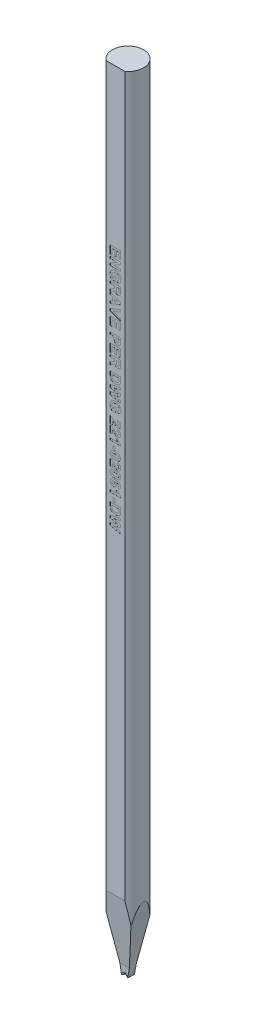
from build123d import *

# Parameters (mm, degrees)
SKETCH_TL_CUTTING_R       = 1.4986
TL_CUTTING_DEPTH          = 75.9968
SKETCH_TDF_GRINDING_W     = 3.0172
SKETCH_TDF_GRINDING_H     = 3.0172
TDF_GRINDING_DEPTH        = 77.026345527
SKETCH_ENGRAVING_W        = 0.166666667
SKETCH_ENGRAVING_H        = 0.371794872
ENGRAVING_DEPTH           = 0.005
VW_VR_GRINDING_DEPTH      = 1.5086
VW_VR_GRINDING_DEPTH_BACK = 1.5086
ISA_GRINDING_DEPTH        = 1.5086
ISA_GRINDING_DEPTH_BACK   = 1.5086
PRE_FRX_BRX_DEPTH         = 1.5086
PRE_FRX_BRX_DEPTH_BACK    = 1.5086
SKETCH_PRE_FRX_BRX_W      = 1.18348
SKETCH_PRE_FRX_BRX_H      = 0.89916
FR_EDM_R                  = 0.14986
BR_EDM_R                  = 0.14986
FA_BA_GRINDING_DEPTH      = 1.5086
FA_BA_GRINDING_DEPTH_BACK = 1.5086


with BuildPart() as part:
    # sketch_TL_cutting → TL_cutting (new body)
    with BuildSketch(Plane(origin=(0, 0, 0), x_dir=(1, 0, 0), z_dir=(0, 1, 0))):
        Circle(SKETCH_TL_CUTTING_R)
    extrude(amount=TL_CUTTING_DEPTH)

    # sketch_TDF_grinding → TDF_grinding (cut, through all)
    with BuildSketch(Plane(origin=(0, 0, 0), x_dir=(1, 0, 0), z_dir=(0, 1, 0))):
        with Locations((0, -2.71002)):
            Rectangle(SKETCH_TDF_GRINDING_W, SKETCH_TDF_GRINDING_H)
    extrude(amount=TDF_GRINDING_DEPTH, mode=Mode.SUBTRACT)

    # sketch_engraving → engraving (cut)
    # profile 1 of 25: a face of its own
    with BuildSketch(Plane.XY.offset(1.20142)):
        Polygon((-0.5, 60.894235897), (0.5, 60.894235897), (0.5, 60.150646154), (0.333333333, 60.150646154), (0.333333333, 60.701928205), (0.115384615, 60.701928205), (0.115384615, 60.189107692), (-0.051282051, 60.189107692), (-0.051282051, 60.701928205), (-0.333333333, 60.701928205), (-0.333333333, 60.137825641), (-0.5, 60.137825641), align=None)
    # profile 2 of 25: a face of its own
    with BuildSketch(Plane.XY.offset(1.20142)):
        Polygon((-0.5, 59.971158974), (0.5, 59.971158974), (0.5, 59.7702375), (-0.157451923, 59.368594872), (0.5, 59.368594872), (0.5, 59.176287179), (-0.5, 59.176287179), (-0.5, 59.38341859), (0.147035256, 59.778851282), (-0.5, 59.778851282), align=None)
    # profile 3 of 25: a face of its own
    with BuildSketch(Plane.XY.offset(1.20142)):
        with BuildLine():
            Line((-0.128205128, 58.522441026), (0.038461538, 58.522441026))
            Line((0.038461538, 58.522441026), (0.038461538, 58.08654359))
            Line((0.038461538, 58.08654359), (-0.36338141, 58.08654359))
            add(Edge.make_bspline(
                [(-0.36338141, 58.08654359), (-0.368321434, 58.092029605), (-0.378419843, 58.103244131), (-0.392661125, 58.121541895), (-0.406257259, 58.14168601), (-0.4194836, 58.1635547), (-0.432233696, 58.187193223), (-0.444685123, 58.212507295), (-0.45671611, 58.239543622), (-0.471787381, 58.277776941), (-0.488186169, 58.326991061), (-0.502445448, 58.387156306), (-0.511191227, 58.447797498), (-0.512277771, 58.488358306), (-0.512820513, 58.50861891)],
                knots=[0, 0, 0, 0, 0.581799769, 1.189316438, 1.825828404, 2.496525428, 3.203088405, 3.942228803, 4.719818701, 5.534979611, 7.181138583, 8.803804008, 10.403462225, 12, 12, 12, 12], degree=3))
            add(Edge.make_bspline(
                [(-0.512820513, 58.50861891), (-0.512629241, 58.521311396), (-0.512252188, 58.546332062), (-0.509233571, 58.583270349), (-0.504017902, 58.618987455), (-0.496780719, 58.653419967), (-0.487836372, 58.686670877), (-0.476607913, 58.718623396), (-0.463065488, 58.749243299), (-0.447986133, 58.778759812), (-0.430657849, 58.806612408), (-0.411724289, 58.832856254), (-0.390891397, 58.857236635), (-0.36853351, 58.879965448), (-0.344060025, 58.900614033), (-0.318106216, 58.919695872), (-0.290219674, 58.936754268), (-0.260879177, 58.95208079), (-0.230317098, 58.965710173), (-0.198781008, 58.977212477), (-0.166726875, 58.987296153), (-0.134042675, 58.995583938), (-0.10062201, 59.001670885), (-0.066619552, 59.00640276), (-0.031822841, 59.008944234), (-0.008417054, 59.009393556), (0.003405449, 59.009620513)],
                knots=[0, 0, 0, 0, 1.124897971, 2.217508473, 3.282174662, 4.322209414, 5.334422951, 6.332119154, 7.320662553, 8.300074908, 9.267468154, 10.225199689, 11.165658754, 12.107290334, 13.047749399, 14.00069605, 14.959944213, 15.942088746, 16.933021067, 17.923599838, 18.915715637, 19.910475908, 20.909926025, 21.925232038, 22.952013513, 24, 24, 24, 24], degree=3))
            add(Edge.make_bspline(
                [(0.003405449, 59.009620513), (0.016165747, 59.009436614), (0.041321811, 59.009074069), (0.078501182, 59.005944425), (0.114594914, 59.00109647), (0.149519517, 58.993701478), (0.183523729, 58.984848027), (0.216299841, 58.973503339), (0.248180515, 58.960549892), (0.278688999, 58.945265774), (0.308028284, 58.928383202), (0.335510174, 58.909199631), (0.361403632, 58.88838003), (0.385591047, 58.865737199), (0.407627145, 58.840898237), (0.428063784, 58.814372539), (0.447146094, 58.78617769), (0.457908016, 58.766000967), (0.463341346, 58.755814423)],
                knots=[0, 0, 0, 0, 1.105132952, 2.178694671, 3.229818344, 4.257558797, 5.269123684, 6.27148554, 7.259679084, 8.247804916, 9.224967877, 10.189258471, 11.147685264, 12.101072275, 13.055511435, 14.02039165, 15.000562851, 16, 16, 16, 16], degree=3))
            add(Edge.make_bspline(
                [(0.463341346, 58.755814423), (0.467347168, 58.747727072), (0.475455657, 58.731356849), (0.485329628, 58.705283756), (0.494054347, 58.677916179), (0.500719187, 58.648934703), (0.506115234, 58.618648224), (0.510216979, 58.586907147), (0.512307439, 58.553652939), (0.512647258, 58.530990515), (0.512820513, 58.519436218)],
                knots=[0, 0, 0, 0, 0.887950456, 1.797368171, 2.741221183, 3.713797788, 4.722103116, 5.768966405, 6.862521341, 8, 8, 8, 8], degree=3))
            add(Edge.make_bspline(
                [(0.512820513, 58.519436218), (0.512598613, 58.504538718), (0.512167059, 58.475565835), (0.508571106, 58.433325541), (0.502373597, 58.393571904), (0.493837942, 58.356249565), (0.482863355, 58.321438928), (0.469371425, 58.289199918), (0.453633675, 58.25933466), (0.435019378, 58.232275716), (0.414494937, 58.207473149), (0.392035387, 58.18499168), (0.367607461, 58.164822262), (0.341334074, 58.146951549), (0.313106625, 58.131520198), (0.283182558, 58.118252182), (0.251334696, 58.107331), (0.22921692, 58.102053034), (0.217948718, 58.099364103)],
                knots=[0, 0, 0, 0, 1.271135529, 2.472123572, 3.614091059, 4.701890498, 5.736279567, 6.724681829, 7.680621489, 8.611506429, 9.52200816, 10.424540711, 11.318996785, 12.221421405, 13.131851814, 14.060431888, 15.011860567, 16, 16, 16, 16], degree=3))
            Line((0.217948718, 58.099364103), (0.179487179, 58.291671795))
            add(Edge.make_bspline(
                [(0.179487179, 58.291671795), (0.185798707, 58.293574377), (0.198251232, 58.297328136), (0.216108293, 58.304634712), (0.232994438, 58.312952834), (0.248643132, 58.322779827), (0.263649233, 58.333217482), (0.277161531, 58.345487665), (0.290187329, 58.358394684), (0.301701762, 58.37288584), (0.312086782, 58.388324395), (0.321450083, 58.404545863), (0.329043783, 58.421914205), (0.335153652, 58.440186828), (0.340342569, 58.459274233), (0.343533767, 58.479425571), (0.345940549, 58.50041453), (0.346081986, 58.514754556), (0.346153846, 58.522040385)],
                knots=[0, 0, 0, 0, 1.027780279, 2.027791312, 3.006028774, 3.96000864, 4.908113241, 5.852721087, 6.802883308, 7.765918715, 8.733730415, 9.704005314, 10.683351261, 11.68471758, 12.707948499, 13.764514378, 14.864202456, 16, 16, 16, 16], degree=3))
            add(Edge.make_bspline(
                [(0.346153846, 58.522040385), (0.345859633, 58.533067741), (0.34528545, 58.554588568), (0.341538784, 58.586006107), (0.334873123, 58.615645672), (0.325679114, 58.64358477), (0.313877959, 58.669874621), (0.299029501, 58.694159968), (0.282012344, 58.717045501), (0.262039987, 58.737879978), (0.239645267, 58.756774481), (0.214561065, 58.773131053), (0.186868462, 58.78674783), (0.156706511, 58.797900746), (0.124073954, 58.806780847), (0.088855272, 58.812804995), (0.051104495, 58.816741063), (0.02505068, 58.817118323), (0.01161859, 58.817312821)],
                knots=[0, 0, 0, 0, 1.043810997, 2.037086103, 2.989314757, 3.91471467, 4.817033861, 5.710208705, 6.603920097, 7.511448416, 8.435617211, 9.371747005, 10.338444094, 11.350425613, 12.411431869, 13.5347293, 14.729025275, 16, 16, 16, 16], degree=3))
            add(Edge.make_bspline(
                [(0.01161859, 58.817312821), (-0.002813331, 58.817110147), (-0.03086261, 58.816716238), (-0.071503034, 58.812881337), (-0.109371212, 58.806583116), (-0.14440027, 58.797515757), (-0.176807311, 58.786208494), (-0.206438048, 58.772228966), (-0.233109204, 58.75542113), (-0.256980675, 58.736358295), (-0.278169336, 58.715321484), (-0.296147735, 58.692258524), (-0.31184176, 58.668000317), (-0.32420794, 58.641860517), (-0.33413508, 58.614312028), (-0.341078682, 58.585085999), (-0.345395871, 58.554287729), (-0.345897627, 58.533206176), (-0.346153846, 58.522441026)],
                knots=[0, 0, 0, 0, 1.31821493, 2.562027667, 3.72541598, 4.821825939, 5.863743127, 6.857000185, 7.808227391, 8.737146514, 9.643023621, 10.529087527, 11.404035307, 12.277173472, 13.164790074, 14.074766194, 15.016892606, 16, 16, 16, 16], degree=3))
            add(Edge.make_bspline(
                [(-0.346153846, 58.522441026), (-0.345850315, 58.511537735), (-0.34524035, 58.489626847), (-0.340086045, 58.456805767), (-0.332449955, 58.423805514), (-0.321065283, 58.391413163), (-0.307937779, 58.360026456), (-0.292687307, 58.330860255), (-0.276962331, 58.303467677), (-0.264654274, 58.2869552), (-0.258613782, 58.278851282)],
                knots=[0, 0, 0, 0, 0.993779204, 1.997065276, 3.023588959, 4.078879359, 5.123947549, 6.123456565, 7.079038607, 8, 8, 8, 8], degree=3))
            Line((-0.258613782, 58.278851282), (-0.128205128, 58.278851282))
            Line((-0.128205128, 58.278851282), (-0.128205128, 58.522441026))
        make_face()
    # profile 4 of 25: a face of its own
    with BuildSketch(Plane.XY.offset(1.20142)):
        with BuildLine():
            Line((-0.5, 57.894235897), (0.5, 57.894235897))
            Line((0.5, 57.894235897), (0.5, 57.474564423))
            add(Edge.make_bspline(
                [(0.5, 57.474564423), (0.499921351, 57.461810201), (0.499769781, 57.437230481), (0.498665723, 57.401683268), (0.496349389, 57.368901265), (0.493735057, 57.338736822), (0.489890849, 57.311277094), (0.485377151, 57.286456079), (0.480042652, 57.264353829), (0.473762142, 57.2447266), (0.46640441, 57.226899938), (0.457825047, 57.210235326), (0.447696774, 57.194575272), (0.436444977, 57.179714477), (0.424039539, 57.165595254), (0.410155618, 57.152603274), (0.394999014, 57.140512567), (0.378696089, 57.129332781), (0.361318758, 57.119484096), (0.343425117, 57.110484982), (0.324824746, 57.103159364), (0.305605269, 57.09710847), (0.285808412, 57.092274923), (0.265383845, 57.088920032), (0.244368538, 57.086825611), (0.230173307, 57.086638641), (0.222956731, 57.08654359)],
                knots=[0, 0, 0, 0, 1.675792322, 3.229558513, 4.671612708, 5.993327294, 7.206773438, 8.313218507, 9.306927966, 10.191988363, 11.018030861, 11.838135071, 12.650980327, 13.465150207, 14.285535933, 15.117196726, 15.959844754, 16.83101188, 17.711363548, 18.582398133, 19.460517458, 20.334551361, 21.228266118, 22.135486512, 23.052118027, 24, 24, 24, 24], degree=3))
            add(Edge.make_bspline(
                [(0.222956731, 57.08654359), (0.213865176, 57.08671771), (0.196097772, 57.087057988), (0.170067915, 57.090259374), (0.145135532, 57.094860931), (0.121515047, 57.101974247), (0.099028777, 57.110818829), (0.077834712, 57.121624821), (0.057734109, 57.134377691), (0.039011166, 57.149143067), (0.021628172, 57.165861702), (0.005964946, 57.184627919), (-0.008142217, 57.205317705), (-0.020271369, 57.228100383), (-0.030960543, 57.252583224), (-0.039742833, 57.279088699), (-0.046961528, 57.30748005), (-0.050349413, 57.327234525), (-0.052083333, 57.337344872)],
                knots=[0, 0, 0, 0, 1.059179627, 2.069928931, 3.052909591, 4.01082991, 4.940120368, 5.865982481, 6.779263376, 7.710344595, 8.640547144, 9.585223395, 10.554458868, 11.553878165, 12.589111246, 13.664634927, 14.804759383, 16, 16, 16, 16], degree=3))
            add(Edge.make_bspline(
                [(-0.052083333, 57.337344872), (-0.058543192, 57.327554557), (-0.071157156, 57.308437315), (-0.092244136, 57.282140986), (-0.113935974, 57.258182324), (-0.13350323, 57.240195798), (-0.150629326, 57.226361316), (-0.165615492, 57.215228495), (-0.182859981, 57.203217912), (-0.202374991, 57.19044991), (-0.22398696, 57.176546224), (-0.248026974, 57.162024206), (-0.274260457, 57.146579885), (-0.292585876, 57.136196031), (-0.302083333, 57.130814423)],
                knots=[0, 0, 0, 0, 1.285482994, 2.510122655, 3.691653098, 4.826411195, 5.419869803, 6.105175889, 6.872935239, 7.723789235, 8.662129684, 9.690525463, 10.803075916, 12, 12, 12, 12], degree=3))
            Line((-0.302083333, 57.130814423), (-0.5, 57.009620513))
            Line((-0.5, 57.009620513), (-0.5, 57.234380128))
            Line((-0.5, 57.234380128), (-0.273036859, 57.376607692))
            add(Edge.make_bspline(
                [(-0.273036859, 57.376607692), (-0.263945443, 57.383137401), (-0.24658806, 57.395603957), (-0.221949287, 57.41363509), (-0.199893124, 57.430036608), (-0.1805544, 57.444827372), (-0.163731826, 57.457827709), (-0.149845803, 57.469482343), (-0.138230202, 57.479219639), (-0.126725879, 57.490254127), (-0.114887633, 57.503080533), (-0.103494307, 57.518942305), (-0.094238036, 57.535123543), (-0.087286311, 57.55262809), (-0.082478883, 57.572919627), (-0.079343719, 57.597279092), (-0.077067211, 57.626432144), (-0.076973557, 57.647502303), (-0.076923077, 57.658859295)],
                knots=[0, 0, 0, 0, 1.465382114, 2.797715724, 3.99708711, 5.063614826, 5.985194575, 6.779875669, 7.43696127, 7.968700361, 8.866038685, 9.717629234, 10.520014012, 11.30082289, 12.174340694, 13.242479345, 14.513673363, 16, 16, 16, 16], degree=3))
            Line((-0.076923077, 57.658859295), (-0.076923077, 57.701928205))
            Line((-0.076923077, 57.701928205), (-0.5, 57.701928205))
            Line((-0.5, 57.701928205), (-0.5, 57.894235897))
        make_face()
        with BuildLine():
            Line((0.08974359, 57.701928205), (0.08974359, 57.547080449))
            add(Edge.make_bspline(
                [(0.08974359, 57.547080449), (0.089768957, 57.5351274), (0.089817287, 57.512354821), (0.090527354, 57.479971991), (0.091115821, 57.451109113), (0.09265079, 57.425809153), (0.094114881, 57.404019334), (0.096069001, 57.385767128), (0.09836301, 57.371028848), (0.101931469, 57.356307986), (0.108148092, 57.341228202), (0.117003495, 57.325158518), (0.128487921, 57.311415466), (0.141777239, 57.299542986), (0.157332372, 57.290378485), (0.174706183, 57.283657484), (0.193862841, 57.279643774), (0.20724563, 57.279120802), (0.214142628, 57.278851282)],
                knots=[0, 0, 0, 0, 1.698120923, 3.235207303, 4.601799022, 5.7989489, 6.835765357, 7.704239165, 8.40605236, 8.953649664, 9.852072573, 10.714567413, 11.550246753, 12.383769498, 13.234656382, 14.099651817, 15.020630301, 16, 16, 16, 16], degree=3))
            add(Edge.make_bspline(
                [(0.214142628, 57.278851282), (0.221852989, 57.27918604), (0.236728888, 57.2798319), (0.257822961, 57.285086949), (0.27662771, 57.293834428), (0.292813882, 57.306323618), (0.306623576, 57.32192236), (0.317392842, 57.340646681), (0.325576055, 57.362091747), (0.328565774, 57.377545804), (0.330128205, 57.385622115)],
                knots=[0, 0, 0, 0, 1.062451802, 2.049829439, 2.976851779, 3.903462222, 4.849641532, 5.832195941, 6.867102576, 8, 8, 8, 8], degree=3))
            add(Edge.make_bspline(
                [(0.330128205, 57.385622115), (0.330421459, 57.388291011), (0.331116534, 57.394616853), (0.331562949, 57.405787541), (0.332249138, 57.420070698), (0.332529569, 57.437639208), (0.333021138, 57.458336115), (0.333111403, 57.482243719), (0.333399792, 57.509286063), (0.333356297, 57.528383752), (0.333333333, 57.538466667)],
                knots=[0, 0, 0, 0, 0.42127143, 0.998501726, 1.753681744, 2.66564073, 3.755712164, 5.002818897, 6.417592707, 8, 8, 8, 8], degree=3))
            Line((0.333333333, 57.538466667), (0.333333333, 57.701928205))
            Line((0.333333333, 57.701928205), (0.08974359, 57.701928205))
        make_face(mode=Mode.SUBTRACT)
    # profile 5 of 25: a face of its own
    with BuildSketch(Plane.XY.offset(1.20142)):
        Polygon((-0.5, 56.035261538), (-0.5, 56.239187821), (-0.269230769, 56.323522756), (-0.269230769, 56.707336859), (-0.5, 56.791671795), (-0.5, 56.9968), (0.5, 56.618795192), (0.5, 56.415069231), align=None)
        Polygon((-0.102564103, 56.384620513), (0.256410256, 56.516030769), (-0.102564103, 56.647040385), align=None, mode=Mode.SUBTRACT)
    # profile 6 of 25: a face of its own
    with BuildSketch(Plane.XY.offset(1.20142)):
        Polygon((-0.5, 55.627008333), (0.5, 55.9968), (0.5, 55.793675), (-0.243589744, 55.528851282), (0.5, 55.265029167), (0.5, 55.060902564), (-0.5, 55.429291987), align=None)
    # profile 7 of 25: a face of its own
    with BuildSketch(Plane.XY.offset(1.20142)):
        Polygon((-0.5, 54.971158974), (0.5, 54.971158974), (0.5, 54.227569231), (0.333333333, 54.227569231), (0.333333333, 54.778851282), (0.115384615, 54.778851282), (0.115384615, 54.266030769), (-0.051282051, 54.266030769), (-0.051282051, 54.778851282), (-0.333333333, 54.778851282), (-0.333333333, 54.214748718), (-0.5, 54.214748718), align=None)
    # profile 8 of 25: a face of its own
    with BuildSketch(Plane.XY.offset(1.20142)):
        with BuildLine():
            Line((-0.5, 53.663466667), (0.5, 53.663466667))
            Line((0.5, 53.663466667), (0.5, 53.343554808))
            add(Edge.make_bspline(
                [(0.5, 53.343554808), (0.4999852, 53.329064455), (0.499956962, 53.301416693), (0.499104777, 53.261884062), (0.497929464, 53.226289855), (0.496434625, 53.194622803), (0.494248137, 53.166966334), (0.491629455, 53.143258956), (0.488933209, 53.123391744), (0.486060508, 53.111634128), (0.484775641, 53.106375321)],
                knots=[0, 0, 0, 0, 1.460492613, 2.786636817, 3.985312262, 5.05006335, 5.98179196, 6.7807735, 7.454678796, 8, 8, 8, 8], degree=3))
            add(Edge.make_bspline(
                [(0.484775641, 53.106375321), (0.482781564, 53.099381959), (0.478823789, 53.085501776), (0.470386441, 53.065615803), (0.460608006, 53.04644887), (0.448953875, 53.028241805), (0.435630967, 53.010932663), (0.420747869, 52.994470188), (0.404237636, 52.978765844), (0.386131953, 52.964039765), (0.366525691, 52.950543742), (0.345376234, 52.938912401), (0.322847402, 52.929051925), (0.298873329, 52.921127517), (0.273610941, 52.914575617), (0.246834559, 52.910393024), (0.218752408, 52.907369504), (0.199528035, 52.9071623), (0.189703526, 52.90705641)],
                knots=[0, 0, 0, 0, 0.907183394, 1.800546498, 2.691728384, 3.591410291, 4.495216108, 5.416087871, 6.359626967, 7.337496937, 8.327236581, 9.327316132, 10.346534403, 11.393207653, 12.477041209, 13.600953845, 14.773980723, 16, 16, 16, 16], degree=3))
            add(Edge.make_bspline(
                [(0.189703526, 52.90705641), (0.174784734, 52.907364918), (0.146065241, 52.907958813), (0.104894137, 52.914608263), (0.067280604, 52.924741168), (0.03361575, 52.939582122), (0.003633111, 52.957595209), (-0.023091697, 52.977763014), (-0.046492635, 53.000246245), (-0.066210989, 53.024825478), (-0.082434, 53.050756803), (-0.096247437, 53.076755341), (-0.106871469, 53.103146515), (-0.11149992, 53.12114078), (-0.113782051, 53.130013141)],
                knots=[0, 0, 0, 0, 1.312446177, 2.526530956, 3.662051072, 4.733637382, 5.754065268, 6.735959421, 7.675686778, 8.604015004, 9.502732733, 10.365317746, 11.193993632, 12, 12, 12, 12], degree=3))
            add(Edge.make_bspline(
                [(-0.113782051, 53.130013141), (-0.114986663, 53.136345752), (-0.11752584, 53.149694139), (-0.120056937, 53.170863883), (-0.122858586, 53.194003561), (-0.124685978, 53.219208347), (-0.126397255, 53.24644775), (-0.127205205, 53.275711194), (-0.128178621, 53.306956857), (-0.128196112, 53.328463031), (-0.128205128, 53.339548397)],
                knots=[0, 0, 0, 0, 0.735353946, 1.55003838, 2.431865514, 3.394945452, 4.432993119, 5.54609699, 6.735134699, 8, 8, 8, 8], degree=3))
            Line((-0.128205128, 53.339548397), (-0.128205128, 53.471158974))
            Line((-0.128205128, 53.471158974), (-0.5, 53.471158974))
            Line((-0.5, 53.471158974), (-0.5, 53.663466667))
        make_face()
        with BuildLine():
            Line((0.333333333, 53.471158974), (0.038461538, 53.471158974))
            Line((0.038461538, 53.471158974), (0.038461538, 53.355774359))
            add(Edge.make_bspline(
                [(0.038461538, 53.355774359), (0.038474423, 53.345824233), (0.038499073, 53.32678839), (0.039383856, 53.299476178), (0.040463899, 53.274753138), (0.04225159, 53.252567611), (0.044607724, 53.233053517), (0.047425958, 53.216080173), (0.050450217, 53.201627797), (0.055461898, 53.18599952), (0.063570342, 53.169289767), (0.075224213, 53.151445715), (0.089157789, 53.135769737), (0.105522293, 53.122725245), (0.123704204, 53.112305583), (0.143517189, 53.104845099), (0.164632877, 53.10002787), (0.179260262, 53.099587861), (0.186698718, 53.099364103)],
                knots=[0, 0, 0, 0, 1.411705958, 2.700771114, 3.876961699, 4.922619712, 5.858038221, 6.66485904, 7.363650596, 7.950905807, 8.989198271, 9.987739806, 10.967313358, 11.951275539, 12.944273208, 13.927870418, 14.946261014, 16, 16, 16, 16], degree=3))
            add(Edge.make_bspline(
                [(0.186698718, 53.099364103), (0.195758642, 53.099679017), (0.213324639, 53.100289596), (0.238341551, 53.10702257), (0.261044702, 53.117410781), (0.280727694, 53.132262972), (0.297279472, 53.15020407), (0.31105114, 53.170369116), (0.320688658, 53.193188742), (0.32442284, 53.209338921), (0.326322115, 53.217553205)],
                knots=[0, 0, 0, 0, 1.085904563, 2.105425768, 3.088705091, 4.068969419, 5.045188284, 6.010769642, 6.988240112, 8, 8, 8, 8], degree=3))
            add(Edge.make_bspline(
                [(0.326322115, 53.217553205), (0.326887477, 53.221087999), (0.328142404, 53.228934146), (0.329452077, 53.241976039), (0.330643223, 53.257404601), (0.331621189, 53.275238428), (0.332385732, 53.295406833), (0.333055661, 53.31797634), (0.333109481, 53.342887507), (0.333256648, 53.36031512), (0.333333333, 53.369396154)],
                knots=[0, 0, 0, 0, 0.564603001, 1.253243608, 2.066786758, 3.005752288, 4.070476343, 5.250658742, 6.567396469, 8, 8, 8, 8], degree=3))
            Line((0.333333333, 53.369396154), (0.333333333, 53.471158974))
        make_face(mode=Mode.SUBTRACT)
    # profile 9 of 25: a face of its own
    with BuildSketch(Plane.XY.offset(1.20142)):
        Polygon((-0.5, 52.740389744), (0.5, 52.740389744), (0.5, 51.9968), (0.333333333, 51.9968), (0.333333333, 52.548082051), (0.115384615, 52.548082051), (0.115384615, 52.035261538), (-0.051282051, 52.035261538), (-0.051282051, 52.548082051), (-0.333333333, 52.548082051), (-0.333333333, 51.983979487), (-0.5, 51.983979487), align=None)
    # profile 10 of 25: a face of its own
    with BuildSketch(Plane.XY.offset(1.20142)):
        with BuildLine():
            Line((-0.5, 51.817312821), (0.5, 51.817312821))
            Line((0.5, 51.817312821), (0.5, 51.397641346))
            add(Edge.make_bspline(
                [(0.5, 51.397641346), (0.499921351, 51.384887124), (0.499769781, 51.360307404), (0.498665723, 51.324760191), (0.496349389, 51.291978188), (0.493735057, 51.261813745), (0.489890849, 51.234354017), (0.485377151, 51.209533002), (0.480042652, 51.187430752), (0.473762142, 51.167803523), (0.46640441, 51.149976861), (0.457825047, 51.133312249), (0.447696774, 51.117652195), (0.436444977, 51.1027914), (0.424039539, 51.088672178), (0.410155618, 51.075680198), (0.394999014, 51.06358949), (0.378696089, 51.052409704), (0.361318758, 51.042561019), (0.343425117, 51.033561905), (0.324824746, 51.026236287), (0.305605269, 51.020185393), (0.285808412, 51.015351846), (0.265383845, 51.011996956), (0.244368538, 51.009902534), (0.230173307, 51.009715564), (0.222956731, 51.009620513)],
                knots=[0, 0, 0, 0, 1.675792322, 3.229558513, 4.671612708, 5.993327294, 7.206773438, 8.313218507, 9.306927966, 10.191988363, 11.018030861, 11.838135071, 12.650980327, 13.465150207, 14.285535933, 15.117196726, 15.959844754, 16.83101188, 17.711363548, 18.582398133, 19.460517458, 20.334551361, 21.228266118, 22.135486512, 23.052118027, 24, 24, 24, 24], degree=3))
            add(Edge.make_bspline(
                [(0.222956731, 51.009620513), (0.213865176, 51.009794633), (0.196097772, 51.010134911), (0.170067915, 51.013336297), (0.145135532, 51.017937854), (0.121515047, 51.02505117), (0.099028777, 51.033895752), (0.077834712, 51.044701744), (0.057734109, 51.057454614), (0.039011166, 51.07221999), (0.021628172, 51.088938625), (0.005964946, 51.107704843), (-0.008142217, 51.128394628), (-0.020271369, 51.151177306), (-0.030960543, 51.175660147), (-0.039742833, 51.202165622), (-0.046961528, 51.230556973), (-0.050349413, 51.250311448), (-0.052083333, 51.260421795)],
                knots=[0, 0, 0, 0, 1.059179627, 2.069928931, 3.052909591, 4.01082991, 4.940120368, 5.865982481, 6.779263376, 7.710344595, 8.640547144, 9.585223395, 10.554458868, 11.553878165, 12.589111246, 13.664634927, 14.804759383, 16, 16, 16, 16], degree=3))
            add(Edge.make_bspline(
                [(-0.052083333, 51.260421795), (-0.058543192, 51.25063148), (-0.071157156, 51.231514238), (-0.092244136, 51.205217909), (-0.113935974, 51.181259247), (-0.13350323, 51.163272722), (-0.150629326, 51.149438239), (-0.165615492, 51.138305418), (-0.182859981, 51.126294835), (-0.202374991, 51.113526833), (-0.22398696, 51.099623147), (-0.248026974, 51.085101129), (-0.274260457, 51.069656808), (-0.292585876, 51.059272954), (-0.302083333, 51.053891346)],
                knots=[0, 0, 0, 0, 1.285482994, 2.510122655, 3.691653098, 4.826411195, 5.419869803, 6.105175889, 6.872935239, 7.723789235, 8.662129684, 9.690525463, 10.803075916, 12, 12, 12, 12], degree=3))
            Line((-0.302083333, 51.053891346), (-0.5, 50.932697436))
            Line((-0.5, 50.932697436), (-0.5, 51.157457051))
            Line((-0.5, 51.157457051), (-0.273036859, 51.299684615))
            add(Edge.make_bspline(
                [(-0.273036859, 51.299684615), (-0.263945443, 51.306214324), (-0.24658806, 51.31868088), (-0.221949287, 51.336712013), (-0.199893124, 51.353113531), (-0.1805544, 51.367904295), (-0.163731826, 51.380904632), (-0.149845803, 51.392559266), (-0.138230202, 51.402296562), (-0.126725879, 51.41333105), (-0.114887633, 51.426157456), (-0.103494307, 51.442019228), (-0.094238036, 51.458200466), (-0.087286311, 51.475705013), (-0.082478883, 51.495996551), (-0.079343719, 51.520356015), (-0.077067211, 51.549509067), (-0.076973557, 51.570579226), (-0.076923077, 51.581936218)],
                knots=[0, 0, 0, 0, 1.465382114, 2.797715724, 3.99708711, 5.063614826, 5.985194575, 6.779875669, 7.43696127, 7.968700361, 8.866038685, 9.717629234, 10.520014012, 11.30082289, 12.174340694, 13.242479345, 14.513673363, 16, 16, 16, 16], degree=3))
            Line((-0.076923077, 51.581936218), (-0.076923077, 51.625005128))
            Line((-0.076923077, 51.625005128), (-0.5, 51.625005128))
            Line((-0.5, 51.625005128), (-0.5, 51.817312821))
        make_face()
        with BuildLine():
            Line((0.08974359, 51.625005128), (0.08974359, 51.470157372))
            add(Edge.make_bspline(
                [(0.08974359, 51.470157372), (0.089768957, 51.458204323), (0.089817287, 51.435431744), (0.090527354, 51.403048914), (0.091115821, 51.374186036), (0.09265079, 51.348886076), (0.094114881, 51.327096257), (0.096069001, 51.308844051), (0.09836301, 51.294105771), (0.101931469, 51.279384909), (0.108148092, 51.264305125), (0.117003495, 51.248235441), (0.128487921, 51.234492389), (0.141777239, 51.222619909), (0.157332372, 51.213455408), (0.174706183, 51.206734407), (0.193862841, 51.202720697), (0.20724563, 51.202197726), (0.214142628, 51.201928205)],
                knots=[0, 0, 0, 0, 1.698120923, 3.235207303, 4.601799022, 5.7989489, 6.835765357, 7.704239165, 8.40605236, 8.953649664, 9.852072573, 10.714567413, 11.550246753, 12.383769498, 13.234656382, 14.099651817, 15.020630301, 16, 16, 16, 16], degree=3))
            add(Edge.make_bspline(
                [(0.214142628, 51.201928205), (0.221852989, 51.202262963), (0.236728888, 51.202908823), (0.257822961, 51.208163872), (0.27662771, 51.216911351), (0.292813882, 51.229400541), (0.306623576, 51.244999283), (0.317392842, 51.263723604), (0.325576055, 51.28516867), (0.328565774, 51.300622727), (0.330128205, 51.308699038)],
                knots=[0, 0, 0, 0, 1.062451802, 2.049829439, 2.976851779, 3.903462222, 4.849641532, 5.832195941, 6.867102576, 8, 8, 8, 8], degree=3))
            add(Edge.make_bspline(
                [(0.330128205, 51.308699038), (0.330421459, 51.311367934), (0.331116534, 51.317693776), (0.331562949, 51.328864464), (0.332249138, 51.343147621), (0.332529569, 51.360716131), (0.333021138, 51.381413038), (0.333111403, 51.405320642), (0.333399792, 51.432362986), (0.333356297, 51.451460675), (0.333333333, 51.46154359)],
                knots=[0, 0, 0, 0, 0.42127143, 0.998501726, 1.753681744, 2.66564073, 3.755712164, 5.002818897, 6.417592707, 8, 8, 8, 8], degree=3))
            Line((0.333333333, 51.46154359), (0.333333333, 51.625005128))
            Line((0.333333333, 51.625005128), (0.08974359, 51.625005128))
        make_face(mode=Mode.SUBTRACT)
    # profile 11 of 25: a face of its own
    with BuildSketch(Plane.XY.offset(1.20142)):
        with BuildLine():
            Line((0.5, 50.432697436), (0.5, 50.065910577))
            add(Edge.make_bspline(
                [(0.5, 50.065910577), (0.500005193, 50.055893032), (0.500015306, 50.036386546), (0.498840892, 50.008077527), (0.497659587, 49.981604956), (0.495294873, 49.957044813), (0.492816233, 49.934311894), (0.489678088, 49.913365404), (0.485656212, 49.894337663), (0.482484481, 49.882338781), (0.480969551, 49.876607692)],
                knots=[0, 0, 0, 0, 1.259756885, 2.453039283, 3.563158368, 4.591894114, 5.55549294, 6.43918076, 7.254497783, 8, 8, 8, 8], degree=3))
            add(Edge.make_bspline(
                [(0.480969551, 49.876607692), (0.478637325, 49.869438716), (0.474014881, 49.855229893), (0.465827813, 49.83437684), (0.455960096, 49.814542941), (0.445111978, 49.79526828), (0.432903728, 49.776996015), (0.419595761, 49.759281335), (0.404753223, 49.742648264), (0.383633179, 49.721113601), (0.35420815, 49.696688717), (0.315375005, 49.670858181), (0.272594656, 49.649120476), (0.234409605, 49.633929103), (0.20183843, 49.623885004), (0.175754603, 49.617316602), (0.148301213, 49.611644929), (0.119383738, 49.607394754), (0.08913491, 49.603733367), (0.057465542, 49.601105699), (0.024383276, 49.599804712), (0.001870575, 49.599512956), (-0.009615385, 49.599364103)],
                knots=[0, 0, 0, 0, 0.745431882, 1.477436776, 2.212739876, 2.934276521, 3.663147754, 4.384200836, 5.123377481, 5.865761747, 7.365547505, 8.894711587, 10.468722596, 12.101948761, 12.951987285, 13.837595333, 14.760899389, 15.722756883, 16.726861385, 17.773652936, 18.864119771, 20, 20, 20, 20], degree=3))
            add(Edge.make_bspline(
                [(-0.009615385, 49.599364103), (-0.0294616, 49.599755507), (-0.067834928, 49.600512302), (-0.123301552, 49.606109673), (-0.17465514, 49.61540511), (-0.206804138, 49.625115536), (-0.222355769, 49.629812821)],
                knots=[0, 0, 0, 0, 1.103491527, 2.133638164, 3.0971734, 4, 4, 4, 4], degree=3))
            add(Edge.make_bspline(
                [(-0.222355769, 49.629812821), (-0.231274521, 49.632986465), (-0.248819098, 49.639229518), (-0.274127236, 49.650154394), (-0.298211673, 49.661958799), (-0.321053432, 49.674740646), (-0.342549771, 49.688564513), (-0.362636394, 49.703482107), (-0.381577746, 49.719262192), (-0.393236239, 49.730693951), (-0.399038462, 49.736383333)],
                knots=[0, 0, 0, 0, 1.090884612, 2.145940218, 3.175104604, 4.181306866, 5.161203701, 6.118658341, 7.063689906, 8, 8, 8, 8], degree=3))
            add(Edge.make_bspline(
                [(-0.399038462, 49.736383333), (-0.407300305, 49.745669607), (-0.424264154, 49.764736893), (-0.445652736, 49.798088411), (-0.464086504, 49.835963738), (-0.473760833, 49.863277629), (-0.478766026, 49.877408974)],
                knots=[0, 0, 0, 0, 0.912008655, 1.872605891, 2.89935344, 4, 4, 4, 4], degree=3))
            add(Edge.make_bspline(
                [(-0.478766026, 49.877408974), (-0.4805228, 49.883128948), (-0.484168894, 49.895000457), (-0.488062998, 49.913823906), (-0.492165475, 49.933918409), (-0.49463687, 49.955515685), (-0.497243066, 49.978391543), (-0.498706299, 50.002728283), (-0.49974511, 50.028441542), (-0.499913777, 50.046077636), (-0.5, 50.055093269)],
                knots=[0, 0, 0, 0, 0.799129865, 1.658552685, 2.566799617, 3.538529252, 4.561352959, 5.643373779, 6.795284424, 8, 8, 8, 8], degree=3))
            Line((-0.5, 50.055093269), (-0.5, 50.432697436))
            Line((-0.5, 50.432697436), (0.5, 50.432697436))
        make_face()
        with BuildLine():
            Line((0.333333333, 50.240389744), (-0.333333333, 50.240389744))
            Line((-0.333333333, 50.240389744), (-0.333333333, 50.082136538))
            add(Edge.make_bspline(
                [(-0.333333333, 50.082136538), (-0.333276671, 50.074991821), (-0.333167574, 50.061235511), (-0.332847006, 50.041329778), (-0.331979167, 50.023036576), (-0.331080228, 50.006260076), (-0.329595022, 49.991043952), (-0.328134266, 49.977321997), (-0.326090699, 49.965170593), (-0.324477534, 49.957665588), (-0.323717949, 49.954131731)],
                knots=[0, 0, 0, 0, 1.333384787, 2.567275092, 3.714769766, 4.750907381, 5.701951617, 6.567520054, 7.325492842, 8, 8, 8, 8], degree=3))
            add(Edge.make_bspline(
                [(-0.323717949, 49.954131731), (-0.321509316, 49.945855036), (-0.317207482, 49.929734219), (-0.307617456, 49.907098961), (-0.296048139, 49.886616969), (-0.282136533, 49.867945232), (-0.26455548, 49.851118131), (-0.242070693, 49.836754145), (-0.215254411, 49.823460653), (-0.189584523, 49.814357267), (-0.16665678, 49.807822874), (-0.147412959, 49.803399626), (-0.126593091, 49.799904053), (-0.104279343, 49.796897404), (-0.080500412, 49.79446796), (-0.055170426, 49.792956245), (-0.028320392, 49.79192449), (-0.009883527, 49.791757622), (-0.000400641, 49.791671795)],
                knots=[0, 0, 0, 0, 1.038686998, 2.023088296, 2.974059649, 3.888265163, 4.839857954, 5.909819677, 7.113156087, 8.466843969, 9.20827164, 10.006482943, 10.861893492, 11.769681931, 12.739021491, 13.762258324, 14.849031541, 16, 16, 16, 16], degree=3))
            add(Edge.make_bspline(
                [(-0.000400641, 49.791671795), (0.009082275, 49.791756962), (0.027452469, 49.791921946), (0.054102292, 49.792952126), (0.079033415, 49.794455325), (0.102276578, 49.796902152), (0.123864169, 49.799861918), (0.143813574, 49.803399353), (0.161996804, 49.807792884), (0.183589283, 49.814345973), (0.207947697, 49.824183458), (0.23429421, 49.838009661), (0.2571147, 49.854274863), (0.276689574, 49.872630019), (0.29287817, 49.893717031), (0.306422028, 49.917087832), (0.316938162, 49.943218741), (0.321416742, 49.961807779), (0.323717949, 49.971359295)],
                knots=[0, 0, 0, 0, 1.118059345, 2.165891593, 3.144157881, 4.062285166, 4.920717571, 5.712910489, 6.449981617, 7.12489426, 8.371943983, 9.541298068, 10.624898781, 11.666293176, 12.69306237, 13.747704633, 14.842713931, 16, 16, 16, 16], degree=3))
            add(Edge.make_bspline(
                [(0.323717949, 49.971359295), (0.324486218, 49.975493605), (0.326177652, 49.984595773), (0.328151987, 49.999700032), (0.329628909, 50.01748664), (0.331099472, 50.037915577), (0.331977905, 50.060965526), (0.332859431, 50.086671032), (0.333166326, 50.115055313), (0.333276065, 50.134887669), (0.333333333, 50.1452375)],
                knots=[0, 0, 0, 0, 0.578739524, 1.274162912, 2.095457587, 3.035141998, 4.093102578, 5.270121571, 6.575369351, 8, 8, 8, 8], degree=3))
            Line((0.333333333, 50.1452375), (0.333333333, 50.240389744))
        make_face(mode=Mode.SUBTRACT)
    # profile 12 of 25: a face of its own
    with BuildSketch(Plane.XY.offset(1.20142)):
        Polygon((-0.5, 49.295878526), (0.5, 49.535261538), (0.5, 49.338146154), (-0.186899038, 49.182697436), (0.5, 49.018234295), (0.5, 48.755814423), (-0.198517628, 48.592953846), (0.5, 48.437905769), (0.5, 48.240389744), (-0.5, 48.475365705), (-0.5, 48.713546795), (0.247596154, 48.887825641), (-0.5, 49.066711859), align=None)
    # profile 13 of 25: a face of its own
    with BuildSketch(Plane.XY.offset(1.20142)):
        with BuildLine():
            Line((-0.128205128, 47.676287179), (0.038461538, 47.676287179))
            Line((0.038461538, 47.676287179), (0.038461538, 47.240389744))
            Line((0.038461538, 47.240389744), (-0.36338141, 47.240389744))
            add(Edge.make_bspline(
                [(-0.36338141, 47.240389744), (-0.368321434, 47.245875759), (-0.378419843, 47.257090285), (-0.392661125, 47.275388049), (-0.406257259, 47.295532164), (-0.4194836, 47.317400854), (-0.432233696, 47.341039376), (-0.444685123, 47.366353449), (-0.45671611, 47.393389776), (-0.471787381, 47.431623095), (-0.488186169, 47.480837215), (-0.502445448, 47.54100246), (-0.511191227, 47.601643651), (-0.512277771, 47.64220446), (-0.512820513, 47.662465064)],
                knots=[0, 0, 0, 0, 0.581799769, 1.189316438, 1.825828404, 2.496525428, 3.203088405, 3.942228803, 4.719818701, 5.534979611, 7.181138583, 8.803804008, 10.403462225, 12, 12, 12, 12], degree=3))
            add(Edge.make_bspline(
                [(-0.512820513, 47.662465064), (-0.512629241, 47.67515755), (-0.512252188, 47.700178215), (-0.509233571, 47.737116503), (-0.504017902, 47.772833609), (-0.496780719, 47.807266121), (-0.487836372, 47.84051703), (-0.476607913, 47.87246955), (-0.463065488, 47.903089453), (-0.447986133, 47.932605966), (-0.430657849, 47.960458562), (-0.411724289, 47.986702408), (-0.390891397, 48.011082789), (-0.36853351, 48.033811601), (-0.344060025, 48.054460187), (-0.318106216, 48.073542026), (-0.290219674, 48.090600422), (-0.260879177, 48.105926944), (-0.230317098, 48.119556327), (-0.198781008, 48.13105863), (-0.166726875, 48.141142307), (-0.134042675, 48.149430092), (-0.10062201, 48.155517039), (-0.066619552, 48.160248914), (-0.031822841, 48.162790388), (-0.008417054, 48.16323971), (0.003405449, 48.163466667)],
                knots=[0, 0, 0, 0, 1.124897971, 2.217508473, 3.282174662, 4.322209414, 5.334422951, 6.332119154, 7.320662553, 8.300074908, 9.267468154, 10.225199689, 11.165658754, 12.107290334, 13.047749399, 14.00069605, 14.959944213, 15.942088746, 16.933021067, 17.923599838, 18.915715637, 19.910475908, 20.909926025, 21.925232038, 22.952013513, 24, 24, 24, 24], degree=3))
            add(Edge.make_bspline(
                [(0.003405449, 48.163466667), (0.016165747, 48.163282768), (0.041321811, 48.162920223), (0.078501182, 48.159790579), (0.114594914, 48.154942624), (0.149519517, 48.147547632), (0.183523729, 48.13869418), (0.216299841, 48.127349493), (0.248180515, 48.114396046), (0.278688999, 48.099111928), (0.308028284, 48.082229356), (0.335510174, 48.063045784), (0.361403632, 48.042226184), (0.385591047, 48.019583353), (0.407627145, 47.994744391), (0.428063784, 47.968218692), (0.447146094, 47.940023844), (0.457908016, 47.919847121), (0.463341346, 47.909660577)],
                knots=[0, 0, 0, 0, 1.105132952, 2.178694671, 3.229818344, 4.257558797, 5.269123684, 6.27148554, 7.259679084, 8.247804916, 9.224967877, 10.189258471, 11.147685264, 12.101072275, 13.055511435, 14.02039165, 15.000562851, 16, 16, 16, 16], degree=3))
            add(Edge.make_bspline(
                [(0.463341346, 47.909660577), (0.467347168, 47.901573226), (0.475455657, 47.885203002), (0.485329628, 47.859129909), (0.494054347, 47.831762333), (0.500719187, 47.802780857), (0.506115234, 47.772494378), (0.510216979, 47.740753301), (0.512307439, 47.707499093), (0.512647258, 47.684836668), (0.512820513, 47.673282372)],
                knots=[0, 0, 0, 0, 0.887950456, 1.797368171, 2.741221183, 3.713797788, 4.722103116, 5.768966405, 6.862521341, 8, 8, 8, 8], degree=3))
            add(Edge.make_bspline(
                [(0.512820513, 47.673282372), (0.512598613, 47.658384872), (0.512167059, 47.629411989), (0.508571106, 47.587171695), (0.502373597, 47.547418058), (0.493837942, 47.510095719), (0.482863355, 47.475285082), (0.469371425, 47.443046072), (0.453633675, 47.413180814), (0.435019378, 47.386121869), (0.414494937, 47.361319302), (0.392035387, 47.338837834), (0.367607461, 47.318668415), (0.341334074, 47.300797703), (0.313106625, 47.285366351), (0.283182558, 47.272098336), (0.251334696, 47.261177154), (0.22921692, 47.255899188), (0.217948718, 47.253210256)],
                knots=[0, 0, 0, 0, 1.271135529, 2.472123572, 3.614091059, 4.701890498, 5.736279567, 6.724681829, 7.680621489, 8.611506429, 9.52200816, 10.424540711, 11.318996785, 12.221421405, 13.131851814, 14.060431888, 15.011860567, 16, 16, 16, 16], degree=3))
            Line((0.217948718, 47.253210256), (0.179487179, 47.445517949))
            add(Edge.make_bspline(
                [(0.179487179, 47.445517949), (0.185798707, 47.447420531), (0.198251232, 47.451174289), (0.216108293, 47.458480866), (0.232994438, 47.466798988), (0.248643132, 47.476625981), (0.263649233, 47.487063636), (0.277161531, 47.499333819), (0.290187329, 47.512240837), (0.301701762, 47.526731994), (0.312086782, 47.542170549), (0.321450083, 47.558392017), (0.329043783, 47.575760359), (0.335153652, 47.594032982), (0.340342569, 47.613120387), (0.343533767, 47.633271725), (0.345940549, 47.654260684), (0.346081986, 47.66860071), (0.346153846, 47.675886538)],
                knots=[0, 0, 0, 0, 1.027780279, 2.027791312, 3.006028774, 3.96000864, 4.908113241, 5.852721087, 6.802883308, 7.765918715, 8.733730415, 9.704005314, 10.683351261, 11.68471758, 12.707948499, 13.764514378, 14.864202456, 16, 16, 16, 16], degree=3))
            add(Edge.make_bspline(
                [(0.346153846, 47.675886538), (0.345859633, 47.686913895), (0.34528545, 47.708434722), (0.341538784, 47.739852261), (0.334873123, 47.769491826), (0.325679114, 47.797430924), (0.313877959, 47.823720775), (0.299029501, 47.848006122), (0.282012344, 47.870891655), (0.262039987, 47.891726131), (0.239645267, 47.910620635), (0.214561065, 47.926977207), (0.186868462, 47.940593984), (0.156706511, 47.9517469), (0.124073954, 47.960627), (0.088855272, 47.966651148), (0.051104495, 47.970587217), (0.02505068, 47.970964477), (0.01161859, 47.971158974)],
                knots=[0, 0, 0, 0, 1.043810997, 2.037086103, 2.989314757, 3.91471467, 4.817033861, 5.710208705, 6.603920097, 7.511448416, 8.435617211, 9.371747005, 10.338444094, 11.350425613, 12.411431869, 13.5347293, 14.729025275, 16, 16, 16, 16], degree=3))
            add(Edge.make_bspline(
                [(0.01161859, 47.971158974), (-0.002813331, 47.9709563), (-0.03086261, 47.970562392), (-0.071503034, 47.966727491), (-0.109371212, 47.960429269), (-0.14440027, 47.951361911), (-0.176807311, 47.940054648), (-0.206438048, 47.92607512), (-0.233109204, 47.909267284), (-0.256980675, 47.890204449), (-0.278169336, 47.869167638), (-0.296147735, 47.846104678), (-0.31184176, 47.82184647), (-0.32420794, 47.795706671), (-0.33413508, 47.768158182), (-0.341078682, 47.738932153), (-0.345395871, 47.708133883), (-0.345897627, 47.68705233), (-0.346153846, 47.676287179)],
                knots=[0, 0, 0, 0, 1.31821493, 2.562027667, 3.72541598, 4.821825939, 5.863743127, 6.857000185, 7.808227391, 8.737146514, 9.643023621, 10.529087527, 11.404035307, 12.277173472, 13.164790074, 14.074766194, 15.016892606, 16, 16, 16, 16], degree=3))
            add(Edge.make_bspline(
                [(-0.346153846, 47.676287179), (-0.345850315, 47.665383888), (-0.34524035, 47.643473001), (-0.340086045, 47.610651921), (-0.332449955, 47.577651668), (-0.321065283, 47.545259317), (-0.307937779, 47.51387261), (-0.292687307, 47.484706408), (-0.276962331, 47.457313831), (-0.264654274, 47.440801354), (-0.258613782, 47.432697436)],
                knots=[0, 0, 0, 0, 0.993779204, 1.997065276, 3.023588959, 4.078879359, 5.123947549, 6.123456565, 7.079038607, 8, 8, 8, 8], degree=3))
            Line((-0.258613782, 47.432697436), (-0.128205128, 47.432697436))
            Line((-0.128205128, 47.432697436), (-0.128205128, 47.676287179))
        make_face()
    # profile 14 of 25: a face of its own
    with BuildSketch(Plane.XY.offset(1.20142)):
        with BuildLine():
            Line((-0.307692308, 46.060902564), (-0.5, 46.060902564))
            Line((-0.5, 46.060902564), (-0.5, 46.714748718))
            add(Edge.make_bspline(
                [(-0.5, 46.714748718), (-0.483565984, 46.712530654), (-0.450707166, 46.708095769), (-0.402658764, 46.694468976), (-0.355879438, 46.675944248), (-0.317848438, 46.656038726), (-0.286923212, 46.636682784), (-0.262057708, 46.618471064), (-0.235074392, 46.59744136), (-0.206603976, 46.572890728), (-0.176093602, 46.545431675), (-0.14381225, 46.514722677), (-0.109876761, 46.480666882), (-0.086834533, 46.456705804), (-0.074919872, 46.444316026)],
                knots=[0, 0, 0, 0, 1.156381417, 2.312114436, 3.475445649, 4.663832578, 5.302694182, 6.020660876, 6.814180865, 7.69035705, 8.644181007, 9.679458435, 10.800095821, 12, 12, 12, 12], degree=3))
            add(Edge.make_bspline(
                [(-0.074919872, 46.444316026), (-0.065377972, 46.434427126), (-0.047213006, 46.415601575), (-0.021173696, 46.38882296), (0.002635387, 46.365215782), (0.024062885, 46.344643513), (0.042867348, 46.326832331), (0.059484162, 46.312261048), (0.073602098, 46.30047526), (0.082565079, 46.29409818), (0.086538462, 46.291271154)],
                knots=[0, 0, 0, 0, 1.480739016, 2.818890974, 4.024686436, 5.093297083, 6.019761393, 6.815071481, 7.474708909, 8, 8, 8, 8], degree=3))
            add(Edge.make_bspline(
                [(0.086538462, 46.291271154), (0.096145343, 46.285452262), (0.114654059, 46.274241524), (0.143960972, 46.262382453), (0.173010268, 46.254642386), (0.192528875, 46.253682229), (0.202123397, 46.253210256)],
                knots=[0, 0, 0, 0, 1.091434863, 2.102769638, 3.067401785, 4, 4, 4, 4], degree=3))
            add(Edge.make_bspline(
                [(0.202123397, 46.253210256), (0.212103794, 46.253563717), (0.230985925, 46.254232438), (0.257559137, 46.260025442), (0.280564781, 46.269853505), (0.299731306, 46.283866716), (0.314878913, 46.301515713), (0.325894297, 46.322272744), (0.332110851, 46.34621057), (0.33291372, 46.363016514), (0.333333333, 46.3718)],
                knots=[0, 0, 0, 0, 1.192552326, 2.256215989, 3.232470907, 4.163657734, 5.069678789, 5.991331675, 6.950186205, 8, 8, 8, 8], degree=3))
            add(Edge.make_bspline(
                [(0.333333333, 46.3718), (0.332938162, 46.380522237), (0.332174776, 46.397371716), (0.325505939, 46.421318482), (0.313961482, 46.442267482), (0.30080546, 46.457196854), (0.288012183, 46.467282352), (0.276863686, 46.474154259), (0.264195574, 46.480077307), (0.250150469, 46.485325621), (0.23456747, 46.489471196), (0.217565257, 46.492809784), (0.199052334, 46.495500204), (0.186173423, 46.496355804), (0.179487179, 46.4968)],
                knots=[0, 0, 0, 0, 1.402788338, 2.709884207, 3.961032948, 5.225417836, 5.883680772, 6.578928686, 7.329201998, 8.132101139, 8.990263233, 9.922304639, 10.921339128, 12, 12, 12, 12], degree=3))
            Line((0.179487179, 46.4968), (0.198317308, 46.689107692))
            add(Edge.make_bspline(
                [(0.198317308, 46.689107692), (0.211300501, 46.687561568), (0.236472838, 46.684563881), (0.272628993, 46.677083101), (0.305984679, 46.667608971), (0.336477992, 46.655689827), (0.364302841, 46.641818301), (0.389041697, 46.625286831), (0.410968596, 46.606673043), (0.430071868, 46.58596085), (0.446412285, 46.563281928), (0.460998615, 46.539484468), (0.472964043, 46.514103402), (0.482825353, 46.487418176), (0.490706433, 46.45944085), (0.495917297, 46.430042025), (0.499582638, 46.399403139), (0.499858783, 46.378488908), (0.5, 46.36779359)],
                knots=[0, 0, 0, 0, 1.270971563, 2.464210789, 3.586263665, 4.638946707, 5.643716971, 6.603612468, 7.52484387, 8.434700188, 9.336036235, 10.239171475, 11.145359471, 12.059630629, 13.003312604, 13.96741569, 14.960557767, 16, 16, 16, 16], degree=3))
            add(Edge.make_bspline(
                [(0.5, 46.36779359), (0.499776553, 46.356166382), (0.499341362, 46.333520936), (0.495746905, 46.300462857), (0.489481026, 46.269406226), (0.48117587, 46.240083839), (0.470106061, 46.212781577), (0.456633778, 46.187277954), (0.440545401, 46.163832121), (0.422288069, 46.142418801), (0.402418882, 46.123199563), (0.380890105, 46.10674528), (0.358545244, 46.092299479), (0.334632005, 46.080959555), (0.309750235, 46.071720569), (0.283460918, 46.065775853), (0.256153456, 46.061428793), (0.237464899, 46.061079914), (0.227964744, 46.060902564)],
                knots=[0, 0, 0, 0, 1.21054264, 2.357683783, 3.456743179, 4.506371233, 5.526380269, 6.518616322, 7.504105716, 8.480749833, 9.444588379, 10.376395364, 11.298423092, 12.209585683, 13.126776925, 14.056012185, 15.011791738, 16, 16, 16, 16], degree=3))
            add(Edge.make_bspline(
                [(0.227964744, 46.060902564), (0.217064496, 46.061147676), (0.195440077, 46.061633942), (0.163469012, 46.066274386), (0.132249846, 46.073399033), (0.101610438, 46.083806753), (0.071147148, 46.097479022), (0.040108962, 46.114216559), (0.008522341, 46.134489624), (-0.012178306, 46.14991537), (-0.022836538, 46.157857692)],
                knots=[0, 0, 0, 0, 0.953498, 1.891593709, 2.82157134, 3.753035249, 4.718494268, 5.740911752, 6.836853288, 8, 8, 8, 8], degree=3))
            add(Edge.make_bspline(
                [(-0.022836538, 46.157857692), (-0.026670091, 46.160896437), (-0.034880672, 46.167404723), (-0.047378398, 46.178510323), (-0.061345658, 46.191114806), (-0.076193638, 46.205796145), (-0.092563957, 46.222015134), (-0.109838998, 46.240201532), (-0.128325502, 46.260171603), (-0.147648705, 46.281122773), (-0.166391428, 46.302283777), (-0.184247543, 46.32163007), (-0.20029985, 46.338962876), (-0.214732899, 46.35411484), (-0.227268639, 46.36735209), (-0.238167377, 46.378422111), (-0.247265417, 46.387503238), (-0.26144337, 46.400019516), (-0.280620183, 46.415944035), (-0.298943771, 46.427147878), (-0.307692308, 46.432497115)],
                knots=[0, 0, 0, 0, 0.665546509, 1.425446362, 2.274432636, 3.225431318, 4.2662943, 5.410247296, 6.638261485, 7.969509561, 9.288545809, 10.484715594, 11.551975365, 12.503234464, 13.332293902, 14.032657109, 14.617374704, 15.080693821, 16.606187002, 18, 18, 18, 18], degree=3))
            Line((-0.307692308, 46.432497115), (-0.307692308, 46.060902564))
        make_face()
    # profile 15 of 25: a face of its own
    with BuildSketch(Plane.XY.offset(1.20142)):
        with BuildLine():
            Line((-0.307692308, 45.291671795), (-0.5, 45.291671795))
            Line((-0.5, 45.291671795), (-0.5, 45.945517949))
            add(Edge.make_bspline(
                [(-0.5, 45.945517949), (-0.483565984, 45.943299884), (-0.450707166, 45.938864999), (-0.402658764, 45.925238206), (-0.355879438, 45.906713479), (-0.317848438, 45.886807957), (-0.286923212, 45.867452014), (-0.262057708, 45.849240295), (-0.235074392, 45.82821059), (-0.206603976, 45.803659959), (-0.176093602, 45.776200906), (-0.14381225, 45.745491908), (-0.109876761, 45.711436112), (-0.086834533, 45.687475035), (-0.074919872, 45.675085256)],
                knots=[0, 0, 0, 0, 1.156381417, 2.312114436, 3.475445649, 4.663832578, 5.302694182, 6.020660876, 6.814180865, 7.69035705, 8.644181007, 9.679458435, 10.800095821, 12, 12, 12, 12], degree=3))
            add(Edge.make_bspline(
                [(-0.074919872, 45.675085256), (-0.065377972, 45.665196357), (-0.047213006, 45.646370806), (-0.021173696, 45.619592191), (0.002635387, 45.595985012), (0.024062885, 45.575412744), (0.042867348, 45.557601561), (0.059484162, 45.543030279), (0.073602098, 45.53124449), (0.082565079, 45.52486741), (0.086538462, 45.522040385)],
                knots=[0, 0, 0, 0, 1.480739016, 2.818890974, 4.024686436, 5.093297083, 6.019761393, 6.815071481, 7.474708909, 8, 8, 8, 8], degree=3))
            add(Edge.make_bspline(
                [(0.086538462, 45.522040385), (0.096145343, 45.516221493), (0.114654059, 45.505010755), (0.143960972, 45.493151684), (0.173010268, 45.485411617), (0.192528875, 45.48445146), (0.202123397, 45.483979487)],
                knots=[0, 0, 0, 0, 1.091434863, 2.102769638, 3.067401785, 4, 4, 4, 4], degree=3))
            add(Edge.make_bspline(
                [(0.202123397, 45.483979487), (0.212103794, 45.484332948), (0.230985925, 45.485001669), (0.257559137, 45.490794672), (0.280564781, 45.500622736), (0.299731306, 45.514635947), (0.314878913, 45.532284944), (0.325894297, 45.553041975), (0.332110851, 45.576979801), (0.33291372, 45.593785744), (0.333333333, 45.602569231)],
                knots=[0, 0, 0, 0, 1.192552326, 2.256215989, 3.232470907, 4.163657734, 5.069678789, 5.991331675, 6.950186205, 8, 8, 8, 8], degree=3))
            add(Edge.make_bspline(
                [(0.333333333, 45.602569231), (0.332938162, 45.611291468), (0.332174776, 45.628140947), (0.325505939, 45.652087713), (0.313961482, 45.673036713), (0.30080546, 45.687966084), (0.288012183, 45.698051583), (0.276863686, 45.70492349), (0.264195574, 45.710846538), (0.250150469, 45.716094852), (0.23456747, 45.720240426), (0.217565257, 45.723579015), (0.199052334, 45.726269434), (0.186173423, 45.727125035), (0.179487179, 45.727569231)],
                knots=[0, 0, 0, 0, 1.402788338, 2.709884207, 3.961032948, 5.225417836, 5.883680772, 6.578928686, 7.329201998, 8.132101139, 8.990263233, 9.922304639, 10.921339128, 12, 12, 12, 12], degree=3))
            Line((0.179487179, 45.727569231), (0.198317308, 45.919876923))
            add(Edge.make_bspline(
                [(0.198317308, 45.919876923), (0.211300501, 45.918330799), (0.236472838, 45.915333111), (0.272628993, 45.907852332), (0.305984679, 45.898378202), (0.336477992, 45.886459058), (0.364302841, 45.872587532), (0.389041697, 45.856056062), (0.410968596, 45.837442273), (0.430071868, 45.816730081), (0.446412285, 45.794051159), (0.460998615, 45.770253699), (0.472964043, 45.744872633), (0.482825353, 45.718187407), (0.490706433, 45.690210081), (0.495917297, 45.660811256), (0.499582638, 45.63017237), (0.499858783, 45.609258138), (0.5, 45.598562821)],
                knots=[0, 0, 0, 0, 1.270971563, 2.464210789, 3.586263665, 4.638946707, 5.643716971, 6.603612468, 7.52484387, 8.434700188, 9.336036235, 10.239171475, 11.145359471, 12.059630629, 13.003312604, 13.96741569, 14.960557767, 16, 16, 16, 16], degree=3))
            add(Edge.make_bspline(
                [(0.5, 45.598562821), (0.499776553, 45.586935613), (0.499341362, 45.564290167), (0.495746905, 45.531232087), (0.489481026, 45.500175457), (0.48117587, 45.47085307), (0.470106061, 45.443550808), (0.456633778, 45.418047185), (0.440545401, 45.394601352), (0.422288069, 45.373188032), (0.402418882, 45.353968794), (0.380890105, 45.337514511), (0.358545244, 45.32306871), (0.334632005, 45.311728786), (0.309750235, 45.3024898), (0.283460918, 45.296545084), (0.256153456, 45.292198024), (0.237464899, 45.291849144), (0.227964744, 45.291671795)],
                knots=[0, 0, 0, 0, 1.21054264, 2.357683783, 3.456743179, 4.506371233, 5.526380269, 6.518616322, 7.504105716, 8.480749833, 9.444588379, 10.376395364, 11.298423092, 12.209585683, 13.126776925, 14.056012185, 15.011791738, 16, 16, 16, 16], degree=3))
            add(Edge.make_bspline(
                [(0.227964744, 45.291671795), (0.217064496, 45.291916907), (0.195440077, 45.292403173), (0.163469012, 45.297043617), (0.132249846, 45.304168264), (0.101610438, 45.314575984), (0.071147148, 45.328248253), (0.040108962, 45.34498579), (0.008522341, 45.365258855), (-0.012178306, 45.380684601), (-0.022836538, 45.388626923)],
                knots=[0, 0, 0, 0, 0.953498, 1.891593709, 2.82157134, 3.753035249, 4.718494268, 5.740911752, 6.836853288, 8, 8, 8, 8], degree=3))
            add(Edge.make_bspline(
                [(-0.022836538, 45.388626923), (-0.026670091, 45.391665668), (-0.034880672, 45.398173954), (-0.047378398, 45.409279554), (-0.061345658, 45.421884037), (-0.076193638, 45.436565375), (-0.092563957, 45.452784365), (-0.109838998, 45.470970763), (-0.128325502, 45.490940833), (-0.147648705, 45.511892003), (-0.166391428, 45.533053008), (-0.184247543, 45.552399301), (-0.20029985, 45.569732107), (-0.214732899, 45.58488407), (-0.227268639, 45.598121321), (-0.238167377, 45.609191342), (-0.247265417, 45.618272469), (-0.26144337, 45.630788747), (-0.280620183, 45.646713266), (-0.298943771, 45.657917109), (-0.307692308, 45.663266346)],
                knots=[0, 0, 0, 0, 0.665546509, 1.425446362, 2.274432636, 3.225431318, 4.2662943, 5.410247296, 6.638261485, 7.969509561, 9.288545809, 10.484715594, 11.551975365, 12.503234464, 13.332293902, 14.032657109, 14.617374704, 15.080693821, 16.606187002, 18, 18, 18, 18], degree=3))
            Line((-0.307692308, 45.663266346), (-0.307692308, 45.291671795))
        make_face()
    # profile 16 of 25: a face of its own
    with BuildSketch(Plane.XY.offset(1.20142)):
        with BuildLine():
            Line((-0.5, 44.689107692), (-0.5, 44.881415385))
            Line((-0.5, 44.881415385), (0.211939103, 44.881415385))
            add(Edge.make_bspline(
                [(0.211939103, 44.881415385), (0.20307606, 44.890119467), (0.185434563, 44.907444561), (0.161132143, 44.935282808), (0.138107764, 44.963814113), (0.117325964, 44.993873228), (0.097979723, 45.02488061), (0.080691796, 45.057235437), (0.064587624, 45.09043651), (0.055729116, 45.113451407), (0.051282051, 45.125005128)],
                knots=[0, 0, 0, 0, 1.012608143, 2.015552075, 3.011331447, 4.000718745, 4.993456561, 5.989905615, 6.990911433, 8, 8, 8, 8], degree=3))
            Line((0.051282051, 45.125005128), (0.243589744, 45.125005128))
            add(Edge.make_bspline(
                [(0.243589744, 45.125005128), (0.248390063, 45.112196937), (0.258436757, 45.085390388), (0.279872721, 45.0458051), (0.306240788, 45.004395093), (0.332145905, 44.969650895), (0.355392216, 44.94232476), (0.373871139, 44.923082931), (0.392879523, 44.905259039), (0.412934946, 44.88950827), (0.433647484, 44.875430595), (0.454979242, 44.862956507), (0.476998664, 44.851976612), (0.492332462, 44.846228688), (0.5, 44.843354487)],
                knots=[0, 0, 0, 0, 1.253621181, 2.623731602, 4.119264342, 5.756158754, 6.594718004, 7.409281336, 8.202581069, 8.983291728, 9.746205797, 10.498494251, 11.24918464, 12, 12, 12, 12], degree=3))
            Line((0.5, 44.843354487), (0.5, 44.689107692))
            Line((0.5, 44.689107692), (-0.5, 44.689107692))
        make_face()
    # profile 17 of 25: a face of its own
    with BuildSketch(Plane.XY.offset(1.20142)):
        with Locations((-0.147435898, 44.195517949)):
            Rectangle(SKETCH_ENGRAVING_W, SKETCH_ENGRAVING_H)
    # profile 18 of 25: a face of its own
    with BuildSketch(Plane.XY.offset(1.20142)):
        with BuildLine():
            add(Edge.make_bspline(
                [(0.5, 43.618594872), (0.49971384, 43.606691152), (0.499156721, 43.583515975), (0.494192381, 43.549753662), (0.486315205, 43.518001079), (0.474936732, 43.488252097), (0.460535804, 43.46035542), (0.442472771, 43.434703569), (0.421624591, 43.410702584), (0.405435577, 43.396846951), (0.397235577, 43.389828846)],
                knots=[0, 0, 0, 0, 1.098626248, 2.138899374, 3.143835643, 4.113754749, 5.073488057, 6.034745239, 7.004566348, 8, 8, 8, 8], degree=3))
            add(Edge.make_bspline(
                [(0.397235577, 43.389828846), (0.392013767, 43.385814147), (0.381356969, 43.377620849), (0.364136726, 43.366586443), (0.345869985, 43.355977838), (0.326116385, 43.346719596), (0.305221356, 43.337846232), (0.283126793, 43.329655467), (0.259707844, 43.322423103), (0.235071142, 43.316118278), (0.209179241, 43.310224781), (0.181968999, 43.305287552), (0.15350924, 43.301062126), (0.123831018, 43.297766892), (0.092992495, 43.294812493), (0.060842825, 43.293195911), (0.027454838, 43.291871421), (0.004742429, 43.291739102), (-0.006810897, 43.291671795)],
                knots=[0, 0, 0, 0, 0.746775751, 1.524038446, 2.317840886, 3.141016509, 3.996283186, 4.892488336, 5.812382473, 6.774967264, 7.776368117, 8.823659909, 9.910833035, 11.039122168, 12.210293276, 13.424012874, 14.68964937, 16, 16, 16, 16], degree=3))
            add(Edge.make_bspline(
                [(-0.006810897, 43.291671795), (-0.01836425, 43.291738088), (-0.041009977, 43.29186803), (-0.074330982, 43.293200847), (-0.106413621, 43.294813935), (-0.13725379, 43.297760007), (-0.166926114, 43.301086882), (-0.195353975, 43.305192426), (-0.22243919, 43.310510918), (-0.248289812, 43.316317572), (-0.27303117, 43.322582231), (-0.296407841, 43.330136054), (-0.318777777, 43.337996456), (-0.339699687, 43.347076052), (-0.359477735, 43.356666525), (-0.377930928, 43.367117265), (-0.395257891, 43.37827488), (-0.40597091, 43.386547443), (-0.411258013, 43.390630128)],
                knots=[0, 0, 0, 0, 1.308411734, 2.564617834, 3.776541518, 4.94597967, 6.0725993, 7.15816376, 8.197872509, 9.197791611, 10.158952087, 11.086962723, 11.979249638, 12.843171697, 13.668427753, 14.467630577, 15.243743175, 16, 16, 16, 16], degree=3))
            add(Edge.make_bspline(
                [(-0.411258013, 43.390630128), (-0.419387722, 43.397584028), (-0.435436162, 43.411311363), (-0.456111536, 43.435046618), (-0.473801555, 43.460657054), (-0.487914093, 43.488503218), (-0.499368982, 43.51810739), (-0.506993451, 43.5499117), (-0.511967929, 43.58358177), (-0.512532265, 43.606757367), (-0.512820513, 43.618594872)],
                knots=[0, 0, 0, 0, 0.991667276, 1.957599061, 2.911530233, 3.873218945, 4.847995157, 5.850445929, 6.902062539, 8, 8, 8, 8], degree=3))
            add(Edge.make_bspline(
                [(-0.512820513, 43.618594872), (-0.512476011, 43.630567287), (-0.511800941, 43.654027856), (-0.506449472, 43.688281303), (-0.497876451, 43.720840776), (-0.485636462, 43.751589388), (-0.469774335, 43.780483143), (-0.45076002, 43.80774777), (-0.427732542, 43.832790102), (-0.40629523, 43.852395515), (-0.386925042, 43.866738894), (-0.37086259, 43.87685519), (-0.353675124, 43.886631512), (-0.33482528, 43.895069653), (-0.314870578, 43.903394629), (-0.293380967, 43.910767941), (-0.270541238, 43.917273113), (-0.246455682, 43.923381055), (-0.220958398, 43.928474179), (-0.194124629, 43.933159106), (-0.165840258, 43.93685108), (-0.136262825, 43.940124396), (-0.105322509, 43.942428998), (-0.073069943, 43.944300629), (-0.039401887, 43.945239123), (-0.01649349, 43.945423762), (-0.004807692, 43.945517949)],
                knots=[0, 0, 0, 0, 1.257818097, 2.464759732, 3.634271214, 4.790227596, 5.933394726, 7.09190477, 8.274482889, 9.50191983, 10.139172818, 10.805000628, 11.49619854, 12.215266328, 12.973768034, 13.768328009, 14.601232062, 15.469317089, 16.379095881, 17.333267023, 18.331755967, 19.376479622, 20.460535752, 21.592206075, 22.771760786, 24, 24, 24, 24], degree=3))
            add(Edge.make_bspline(
                [(-0.004807692, 43.945517949), (0.006678925, 43.945452154), (0.02919122, 43.945323205), (0.062378132, 43.943981102), (0.094328674, 43.942387788), (0.12509981, 43.939415174), (0.154640959, 43.936115669), (0.183004063, 43.932003048), (0.209982531, 43.926584968), (0.235876189, 43.921235897), (0.260431507, 43.914495936), (0.2837906, 43.907070629), (0.306110518, 43.89923629), (0.326924245, 43.890064007), (0.346659803, 43.880529052), (0.365109758, 43.870070992), (0.382437536, 43.85891522), (0.39315045, 43.850642418), (0.3984375, 43.846559615)],
                knots=[0, 0, 0, 0, 1.304443357, 2.556541329, 3.771813033, 4.936929721, 6.066661712, 7.147723817, 8.190304831, 9.191350322, 10.149780912, 11.080355239, 11.975107155, 12.834450748, 13.66198663, 14.463397305, 15.241653965, 16, 16, 16, 16], degree=3))
            add(Edge.make_bspline(
                [(0.3984375, 43.846559615), (0.406566428, 43.839605333), (0.422613323, 43.825877243), (0.443299998, 43.802147515), (0.460913987, 43.776565362), (0.475197493, 43.748800455), (0.486497465, 43.719128261), (0.494183265, 43.687282275), (0.499144648, 43.653606839), (0.499710816, 43.630431993), (0.5, 43.618594872)],
                knots=[0, 0, 0, 0, 0.991631672, 1.957528776, 2.911425699, 3.867574088, 4.848108326, 5.850523106, 6.902101959, 8, 8, 8, 8], degree=3))
        make_face()
        with BuildLine():
            add(Edge.make_bspline(
                [(0.333333333, 43.618594872), (0.333068079, 43.624762838), (0.332548986, 43.636833312), (0.328316127, 43.654388248), (0.321759633, 43.670969319), (0.312130705, 43.686527359), (0.299093083, 43.700935934), (0.281476094, 43.713143812), (0.259881539, 43.723697315), (0.243736, 43.728976924), (0.235176282, 43.731775962)],
                knots=[0, 0, 0, 0, 0.909107913, 1.77908945, 2.650019014, 3.530482969, 4.465025013, 5.495890128, 6.672421267, 8, 8, 8, 8], degree=3))
            add(Edge.make_bspline(
                [(0.235176282, 43.731775962), (0.228718042, 43.73352415), (0.214837576, 43.737281471), (0.192206647, 43.741545874), (0.166522939, 43.745062639), (0.137792419, 43.748032192), (0.105999886, 43.750448782), (0.071125109, 43.751937001), (0.033192525, 43.752965632), (0.006878451, 43.753126545), (-0.006810897, 43.753210256)],
                knots=[0, 0, 0, 0, 0.658986521, 1.416336438, 2.266694271, 3.212608458, 4.261595115, 5.407496572, 6.651304179, 8, 8, 8, 8], degree=3))
            add(Edge.make_bspline(
                [(-0.006810897, 43.753210256), (-0.020433943, 43.753219271), (-0.046549094, 43.753236551), (-0.084006477, 43.752062317), (-0.118154033, 43.750894874), (-0.148991056, 43.748525215), (-0.176626244, 43.746187046), (-0.200847568, 43.742649497), (-0.221857789, 43.739096762), (-0.244486895, 43.733063307), (-0.268257705, 43.724747548), (-0.292448985, 43.71351913), (-0.311537375, 43.700853212), (-0.325415776, 43.686321741), (-0.334597404, 43.670576483), (-0.341538269, 43.654272549), (-0.345246665, 43.636720709), (-0.345848983, 43.624686167), (-0.346153846, 43.618594872)],
                knots=[0, 0, 0, 0, 1.613038927, 3.092168624, 4.43749063, 5.658264602, 6.75425577, 7.720394221, 8.556328411, 9.275513998, 10.490872946, 11.534172084, 12.42681833, 13.187531851, 13.88996177, 14.574222125, 15.278341114, 16, 16, 16, 16], degree=3))
            add(Edge.make_bspline(
                [(-0.346153846, 43.618594872), (-0.345874419, 43.612497034), (-0.345321688, 43.600434953), (-0.341225408, 43.582902986), (-0.334465655, 43.56634549), (-0.325029126, 43.550682646), (-0.311901617, 43.536260564), (-0.294300445, 43.524043768), (-0.272700888, 43.513493084), (-0.25655611, 43.508213047), (-0.247996795, 43.505413782)],
                knots=[0, 0, 0, 0, 0.899391665, 1.779078861, 2.640979247, 3.529945348, 4.464599804, 5.495588918, 6.672261578, 8, 8, 8, 8], degree=3))
            add(Edge.make_bspline(
                [(-0.247996795, 43.505413782), (-0.241538043, 43.503668122), (-0.227719754, 43.49993334), (-0.205229709, 43.49563855), (-0.179679092, 43.492112263), (-0.151079269, 43.489170945), (-0.11935541, 43.486730585), (-0.084546407, 43.485254999), (-0.046680798, 43.484225401), (-0.020433482, 43.48406351), (-0.006810897, 43.483979487)],
                knots=[0, 0, 0, 0, 0.66114423, 1.414496391, 2.261103113, 3.210114492, 4.255954433, 5.405607896, 6.653488082, 8, 8, 8, 8], degree=3))
            add(Edge.make_bspline(
                [(-0.006810897, 43.483979487), (0.006810741, 43.484093263), (0.032921137, 43.484311353), (0.070464093, 43.484938245), (0.104645163, 43.48669316), (0.13553417, 43.48844938), (0.163028833, 43.491414785), (0.187277888, 43.494357691), (0.208178651, 43.49842982), (0.23096624, 43.504021851), (0.254848985, 43.512359833), (0.278913284, 43.523931994), (0.298191428, 43.536369064), (0.312146257, 43.550876033), (0.321683592, 43.566594198), (0.328364426, 43.583046528), (0.332523972, 43.600495685), (0.333060584, 43.612495564), (0.333333333, 43.618594872)],
                knots=[0, 0, 0, 0, 1.611458614, 3.088895909, 4.441089836, 5.660086535, 6.747875232, 7.711965119, 8.548505902, 9.26500436, 10.486583113, 11.532259092, 12.419544583, 13.184925779, 13.890764661, 14.581638641, 15.279074115, 16, 16, 16, 16], degree=3))
        make_face(mode=Mode.SUBTRACT)
    # profile 19 of 25: a face of its own
    with BuildSketch(Plane.XY.offset(1.20142)):
        with BuildLine():
            Line((-0.307692308, 42.522441026), (-0.5, 42.522441026))
            Line((-0.5, 42.522441026), (-0.5, 43.176287179))
            add(Edge.make_bspline(
                [(-0.5, 43.176287179), (-0.483565984, 43.174069115), (-0.450707166, 43.16963423), (-0.402658764, 43.156007437), (-0.355879438, 43.13748271), (-0.317848438, 43.117577188), (-0.286923212, 43.098221245), (-0.262057708, 43.080009526), (-0.235074392, 43.058979821), (-0.206603976, 43.034429189), (-0.176093602, 43.006970137), (-0.14381225, 42.976261138), (-0.109876761, 42.942205343), (-0.086834533, 42.918244266), (-0.074919872, 42.905854487)],
                knots=[0, 0, 0, 0, 1.156381417, 2.312114436, 3.475445649, 4.663832578, 5.302694182, 6.020660876, 6.814180865, 7.69035705, 8.644181007, 9.679458435, 10.800095821, 12, 12, 12, 12], degree=3))
            add(Edge.make_bspline(
                [(-0.074919872, 42.905854487), (-0.065377972, 42.895965588), (-0.047213006, 42.877140037), (-0.021173696, 42.850361422), (0.002635387, 42.826754243), (0.024062885, 42.806181975), (0.042867348, 42.788370792), (0.059484162, 42.77379951), (0.073602098, 42.762013721), (0.082565079, 42.755636641), (0.086538462, 42.752809615)],
                knots=[0, 0, 0, 0, 1.480739016, 2.818890974, 4.024686436, 5.093297083, 6.019761393, 6.815071481, 7.474708909, 8, 8, 8, 8], degree=3))
            add(Edge.make_bspline(
                [(0.086538462, 42.752809615), (0.096145343, 42.746990723), (0.114654059, 42.735779986), (0.143960972, 42.723920915), (0.173010268, 42.716180847), (0.192528875, 42.71522069), (0.202123397, 42.714748718)],
                knots=[0, 0, 0, 0, 1.091434863, 2.102769638, 3.067401785, 4, 4, 4, 4], degree=3))
            add(Edge.make_bspline(
                [(0.202123397, 42.714748718), (0.212103794, 42.715102179), (0.230985925, 42.715770899), (0.257559137, 42.721563903), (0.280564781, 42.731391966), (0.299731306, 42.745405177), (0.314878913, 42.763054174), (0.325894297, 42.783811205), (0.332110851, 42.807749032), (0.33291372, 42.824554975), (0.333333333, 42.833338462)],
                knots=[0, 0, 0, 0, 1.192552326, 2.256215989, 3.232470907, 4.163657734, 5.069678789, 5.991331675, 6.950186205, 8, 8, 8, 8], degree=3))
            add(Edge.make_bspline(
                [(0.333333333, 42.833338462), (0.332938162, 42.842060699), (0.332174776, 42.858910178), (0.325505939, 42.882856943), (0.313961482, 42.903805943), (0.30080546, 42.918735315), (0.288012183, 42.928820814), (0.276863686, 42.935692721), (0.264195574, 42.941615768), (0.250150469, 42.946864082), (0.23456747, 42.951009657), (0.217565257, 42.954348246), (0.199052334, 42.957038665), (0.186173423, 42.957894266), (0.179487179, 42.958338462)],
                knots=[0, 0, 0, 0, 1.402788338, 2.709884207, 3.961032948, 5.225417836, 5.883680772, 6.578928686, 7.329201998, 8.132101139, 8.990263233, 9.922304639, 10.921339128, 12, 12, 12, 12], degree=3))
            Line((0.179487179, 42.958338462), (0.198317308, 43.150646154))
            add(Edge.make_bspline(
                [(0.198317308, 43.150646154), (0.211300501, 43.14910003), (0.236472838, 43.146102342), (0.272628993, 43.138621563), (0.305984679, 43.129147433), (0.336477992, 43.117228289), (0.364302841, 43.103356763), (0.389041697, 43.086825292), (0.410968596, 43.068211504), (0.430071868, 43.047499312), (0.446412285, 43.024820389), (0.460998615, 43.00102293), (0.472964043, 42.975641864), (0.482825353, 42.948956638), (0.490706433, 42.920979312), (0.495917297, 42.891580486), (0.499582638, 42.860941601), (0.499858783, 42.840027369), (0.5, 42.829332051)],
                knots=[0, 0, 0, 0, 1.270971563, 2.464210789, 3.586263665, 4.638946707, 5.643716971, 6.603612468, 7.52484387, 8.434700188, 9.336036235, 10.239171475, 11.145359471, 12.059630629, 13.003312604, 13.96741569, 14.960557767, 16, 16, 16, 16], degree=3))
            add(Edge.make_bspline(
                [(0.5, 42.829332051), (0.499776553, 42.817704844), (0.499341362, 42.795059397), (0.495746905, 42.762001318), (0.489481026, 42.730944687), (0.48117587, 42.701622301), (0.470106061, 42.674320039), (0.456633778, 42.648816416), (0.440545401, 42.625370583), (0.422288069, 42.603957263), (0.402418882, 42.584738025), (0.380890105, 42.568283741), (0.358545244, 42.553837941), (0.334632005, 42.542498017), (0.309750235, 42.533259031), (0.283460918, 42.527314315), (0.256153456, 42.522967255), (0.237464899, 42.522618375), (0.227964744, 42.522441026)],
                knots=[0, 0, 0, 0, 1.21054264, 2.357683783, 3.456743179, 4.506371233, 5.526380269, 6.518616322, 7.504105716, 8.480749833, 9.444588379, 10.376395364, 11.298423092, 12.209585683, 13.126776925, 14.056012185, 15.011791738, 16, 16, 16, 16], degree=3))
            add(Edge.make_bspline(
                [(0.227964744, 42.522441026), (0.217064496, 42.522686138), (0.195440077, 42.523172403), (0.163469012, 42.527812847), (0.132249846, 42.534937495), (0.101610438, 42.545345214), (0.071147148, 42.559017484), (0.040108962, 42.57575502), (0.008522341, 42.596028085), (-0.012178306, 42.611453832), (-0.022836538, 42.619396154)],
                knots=[0, 0, 0, 0, 0.953498, 1.891593709, 2.82157134, 3.753035249, 4.718494268, 5.740911752, 6.836853288, 8, 8, 8, 8], degree=3))
            add(Edge.make_bspline(
                [(-0.022836538, 42.619396154), (-0.026670091, 42.622434898), (-0.034880672, 42.628943185), (-0.047378398, 42.640048784), (-0.061345658, 42.652653267), (-0.076193638, 42.667334606), (-0.092563957, 42.683553596), (-0.109838998, 42.701739994), (-0.128325502, 42.721710064), (-0.147648705, 42.742661234), (-0.166391428, 42.763822239), (-0.184247543, 42.783168532), (-0.20029985, 42.800501338), (-0.214732899, 42.815653301), (-0.227268639, 42.828890551), (-0.238167377, 42.839960572), (-0.247265417, 42.8490417), (-0.26144337, 42.861557978), (-0.280620183, 42.877482497), (-0.298943771, 42.88868634), (-0.307692308, 42.894035577)],
                knots=[0, 0, 0, 0, 0.665546509, 1.425446362, 2.274432636, 3.225431318, 4.2662943, 5.410247296, 6.638261485, 7.969509561, 9.288545809, 10.484715594, 11.551975365, 12.503234464, 13.332293902, 14.032657109, 14.617374704, 15.080693821, 16.606187002, 18, 18, 18, 18], degree=3))
            Line((-0.307692308, 42.894035577), (-0.307692308, 42.522441026))
        make_face()
    # profile 20 of 25: a face of its own
    with BuildSketch(Plane.XY.offset(1.20142)):
        with BuildLine():
            add(Edge.make_bspline(
                [(0.5, 42.080133333), (0.49971384, 42.068229614), (0.499156721, 42.045054436), (0.494192381, 42.011292124), (0.486315205, 41.979539541), (0.474936732, 41.949790558), (0.460535804, 41.921893882), (0.442472771, 41.896242031), (0.421624591, 41.872241046), (0.405435577, 41.858385412), (0.397235577, 41.851367308)],
                knots=[0, 0, 0, 0, 1.098626248, 2.138899374, 3.143835643, 4.113754749, 5.073488057, 6.034745239, 7.004566348, 8, 8, 8, 8], degree=3))
            add(Edge.make_bspline(
                [(0.397235577, 41.851367308), (0.392013767, 41.847352608), (0.381356969, 41.83915931), (0.364136726, 41.828124905), (0.345869985, 41.8175163), (0.326116385, 41.808258057), (0.305221356, 41.799384694), (0.283126793, 41.791193929), (0.259707844, 41.783961565), (0.235071142, 41.777656739), (0.209179241, 41.771763242), (0.181968999, 41.766826013), (0.15350924, 41.762600588), (0.123831018, 41.759305354), (0.092992495, 41.756350955), (0.060842825, 41.754734373), (0.027454838, 41.753409882), (0.004742429, 41.753277564), (-0.006810897, 41.753210256)],
                knots=[0, 0, 0, 0, 0.746775751, 1.524038446, 2.317840886, 3.141016509, 3.996283186, 4.892488336, 5.812382473, 6.774967264, 7.776368117, 8.823659909, 9.910833035, 11.039122168, 12.210293276, 13.424012874, 14.68964937, 16, 16, 16, 16], degree=3))
            add(Edge.make_bspline(
                [(-0.006810897, 41.753210256), (-0.01836425, 41.75327655), (-0.041009977, 41.753406492), (-0.074330982, 41.754739309), (-0.106413621, 41.756352396), (-0.13725379, 41.759298468), (-0.166926114, 41.762625343), (-0.195353975, 41.766730888), (-0.22243919, 41.77204938), (-0.248289812, 41.777856033), (-0.27303117, 41.784120692), (-0.296407841, 41.791674516), (-0.318777777, 41.799534918), (-0.339699687, 41.808614514), (-0.359477735, 41.818204987), (-0.377930928, 41.828655727), (-0.395257891, 41.839813341), (-0.40597091, 41.848085904), (-0.411258013, 41.85216859)],
                knots=[0, 0, 0, 0, 1.308411734, 2.564617834, 3.776541518, 4.94597967, 6.0725993, 7.15816376, 8.197872509, 9.197791611, 10.158952087, 11.086962723, 11.979249638, 12.843171697, 13.668427753, 14.467630577, 15.243743175, 16, 16, 16, 16], degree=3))
            add(Edge.make_bspline(
                [(-0.411258013, 41.85216859), (-0.419387722, 41.85912249), (-0.435436162, 41.872849825), (-0.456111536, 41.89658508), (-0.473801555, 41.922195516), (-0.487914093, 41.950041679), (-0.499368982, 41.979645852), (-0.506993451, 42.011450161), (-0.511967929, 42.045120231), (-0.512532265, 42.068295829), (-0.512820513, 42.080133333)],
                knots=[0, 0, 0, 0, 0.991667276, 1.957599061, 2.911530233, 3.873218945, 4.847995157, 5.850445929, 6.902062539, 8, 8, 8, 8], degree=3))
            add(Edge.make_bspline(
                [(-0.512820513, 42.080133333), (-0.512476011, 42.092105749), (-0.511800941, 42.115566317), (-0.506449472, 42.149819764), (-0.497876451, 42.182379237), (-0.485636462, 42.213127849), (-0.469774335, 42.242021604), (-0.45076002, 42.269286231), (-0.427732542, 42.294328563), (-0.40629523, 42.313933977), (-0.386925042, 42.328277356), (-0.37086259, 42.338393652), (-0.353675124, 42.348169974), (-0.33482528, 42.356608115), (-0.314870578, 42.36493309), (-0.293380967, 42.372306403), (-0.270541238, 42.378811574), (-0.246455682, 42.384919517), (-0.220958398, 42.390012641), (-0.194124629, 42.394697567), (-0.165840258, 42.398389542), (-0.136262825, 42.401662858), (-0.105322509, 42.40396746), (-0.073069943, 42.40583909), (-0.039401887, 42.406777584), (-0.01649349, 42.406962224), (-0.004807692, 42.40705641)],
                knots=[0, 0, 0, 0, 1.257818097, 2.464759732, 3.634271214, 4.790227596, 5.933394726, 7.09190477, 8.274482889, 9.50191983, 10.139172818, 10.805000628, 11.49619854, 12.215266328, 12.973768034, 13.768328009, 14.601232062, 15.469317089, 16.379095881, 17.333267023, 18.331755967, 19.376479622, 20.460535752, 21.592206075, 22.771760786, 24, 24, 24, 24], degree=3))
            add(Edge.make_bspline(
                [(-0.004807692, 42.40705641), (0.006678925, 42.406990616), (0.02919122, 42.406861667), (0.062378132, 42.405519563), (0.094328674, 42.403926249), (0.12509981, 42.400953635), (0.154640959, 42.39765413), (0.183004063, 42.393541509), (0.209982531, 42.38812343), (0.235876189, 42.382774359), (0.260431507, 42.376034397), (0.2837906, 42.36860909), (0.306110518, 42.360774752), (0.326924245, 42.351602469), (0.346659803, 42.342067513), (0.365109758, 42.331609453), (0.382437536, 42.320453681), (0.39315045, 42.31218088), (0.3984375, 42.308098077)],
                knots=[0, 0, 0, 0, 1.304443357, 2.556541329, 3.771813033, 4.936929721, 6.066661712, 7.147723817, 8.190304831, 9.191350322, 10.149780912, 11.080355239, 11.975107155, 12.834450748, 13.66198663, 14.463397305, 15.241653965, 16, 16, 16, 16], degree=3))
            add(Edge.make_bspline(
                [(0.3984375, 42.308098077), (0.406566428, 42.301143794), (0.422613323, 42.287415705), (0.443299998, 42.263685976), (0.460913987, 42.238103824), (0.475197493, 42.210338916), (0.486497465, 42.180666723), (0.494183265, 42.148820737), (0.499144648, 42.115145301), (0.499710816, 42.091970455), (0.5, 42.080133333)],
                knots=[0, 0, 0, 0, 0.991631672, 1.957528776, 2.911425699, 3.867574088, 4.848108326, 5.850523106, 6.902101959, 8, 8, 8, 8], degree=3))
        make_face()
        with BuildLine():
            add(Edge.make_bspline(
                [(0.333333333, 42.080133333), (0.333068079, 42.0863013), (0.332548986, 42.098371774), (0.328316127, 42.11592671), (0.321759633, 42.132507781), (0.312130705, 42.148065821), (0.299093083, 42.162474395), (0.281476094, 42.174682273), (0.259881539, 42.185235777), (0.243736, 42.190515386), (0.235176282, 42.193314423)],
                knots=[0, 0, 0, 0, 0.909107913, 1.77908945, 2.650019014, 3.530482969, 4.465025013, 5.495890128, 6.672421267, 8, 8, 8, 8], degree=3))
            add(Edge.make_bspline(
                [(0.235176282, 42.193314423), (0.228718042, 42.195062612), (0.214837576, 42.198819933), (0.192206647, 42.203084335), (0.166522939, 42.206601101), (0.137792419, 42.209570653), (0.105999886, 42.211987244), (0.071125109, 42.213475463), (0.033192525, 42.214504093), (0.006878451, 42.214665006), (-0.006810897, 42.214748718)],
                knots=[0, 0, 0, 0, 0.658986521, 1.416336438, 2.266694271, 3.212608458, 4.261595115, 5.407496572, 6.651304179, 8, 8, 8, 8], degree=3))
            add(Edge.make_bspline(
                [(-0.006810897, 42.214748718), (-0.020433943, 42.214757732), (-0.046549094, 42.214775012), (-0.084006477, 42.213600778), (-0.118154033, 42.212433336), (-0.148991056, 42.210063677), (-0.176626244, 42.207725507), (-0.200847568, 42.204187958), (-0.221857789, 42.200635224), (-0.244486895, 42.194601769), (-0.268257705, 42.18628601), (-0.292448985, 42.175057592), (-0.311537375, 42.162391674), (-0.325415776, 42.147860203), (-0.334597404, 42.132114945), (-0.341538269, 42.11581101), (-0.345246665, 42.09825917), (-0.345848983, 42.086224629), (-0.346153846, 42.080133333)],
                knots=[0, 0, 0, 0, 1.613038927, 3.092168624, 4.43749063, 5.658264602, 6.75425577, 7.720394221, 8.556328411, 9.275513998, 10.490872946, 11.534172084, 12.42681833, 13.187531851, 13.88996177, 14.574222125, 15.278341114, 16, 16, 16, 16], degree=3))
            add(Edge.make_bspline(
                [(-0.346153846, 42.080133333), (-0.345874419, 42.074035495), (-0.345321688, 42.061973414), (-0.341225408, 42.044441448), (-0.334465655, 42.027883952), (-0.325029126, 42.012221108), (-0.311901617, 41.997799026), (-0.294300445, 41.98558223), (-0.272700888, 41.975031546), (-0.25655611, 41.969751508), (-0.247996795, 41.966952244)],
                knots=[0, 0, 0, 0, 0.899391665, 1.779078861, 2.640979247, 3.529945348, 4.464599804, 5.495588918, 6.672261578, 8, 8, 8, 8], degree=3))
            add(Edge.make_bspline(
                [(-0.247996795, 41.966952244), (-0.241538043, 41.965206584), (-0.227719754, 41.961471801), (-0.205229709, 41.957177011), (-0.179679092, 41.953650725), (-0.151079269, 41.950709407), (-0.11935541, 41.948269046), (-0.084546407, 41.94679346), (-0.046680798, 41.945763862), (-0.020433482, 41.945601971), (-0.006810897, 41.945517949)],
                knots=[0, 0, 0, 0, 0.66114423, 1.414496391, 2.261103113, 3.210114492, 4.255954433, 5.405607896, 6.653488082, 8, 8, 8, 8], degree=3))
            add(Edge.make_bspline(
                [(-0.006810897, 41.945517949), (0.006810741, 41.945631725), (0.032921137, 41.945849814), (0.070464093, 41.946476707), (0.104645163, 41.948231622), (0.13553417, 41.949987842), (0.163028833, 41.952953246), (0.187277888, 41.955896153), (0.208178651, 41.959968282), (0.23096624, 41.965560312), (0.254848985, 41.973898295), (0.278913284, 41.985470455), (0.298191428, 41.997907525), (0.312146257, 42.012414495), (0.321683592, 42.028132659), (0.328364426, 42.04458499), (0.332523972, 42.062034147), (0.333060584, 42.074034025), (0.333333333, 42.080133333)],
                knots=[0, 0, 0, 0, 1.611458614, 3.088895909, 4.441089836, 5.660086535, 6.747875232, 7.711965119, 8.548505902, 9.26500436, 10.486583113, 11.532259092, 12.419544583, 13.184925779, 13.890764661, 14.581638641, 15.279074115, 16, 16, 16, 16], degree=3))
        make_face(mode=Mode.SUBTRACT)
    # profile 21 of 25: a face of its own
    with BuildSketch(Plane.XY.offset(1.20142)):
        with BuildLine():
            Line((0.238982372, 41.009620513), (0.217948718, 41.201928205))
            add(Edge.make_bspline(
                [(0.217948718, 41.201928205), (0.227222206, 41.203185003), (0.244692803, 41.205552722), (0.268597778, 41.213128344), (0.288985169, 41.222770322), (0.305367333, 41.235668828), (0.318033901, 41.250932587), (0.327024813, 41.268354225), (0.332364239, 41.287889219), (0.333002116, 41.301586647), (0.333333333, 41.308699038)],
                knots=[0, 0, 0, 0, 1.28093875, 2.413198347, 3.424580245, 4.356906905, 5.247853606, 6.124190523, 7.025985721, 8, 8, 8, 8], degree=3))
            add(Edge.make_bspline(
                [(0.333333333, 41.308699038), (0.3332154, 41.313522073), (0.332980718, 41.323119668), (0.330001189, 41.33709973), (0.32557955, 41.350578192), (0.31931723, 41.36344505), (0.311236866, 41.375764503), (0.301241877, 41.387349266), (0.289859122, 41.398731938), (0.27611391, 41.409242545), (0.259838616, 41.419326249), (0.239914585, 41.428008726), (0.21636033, 41.435747423), (0.189060487, 41.442373405), (0.158188337, 41.448386415), (0.123618909, 41.453315376), (0.085321141, 41.457259501), (0.058500014, 41.459151652), (0.044471154, 41.460141346)],
                knots=[0, 0, 0, 0, 0.642458078, 1.278459126, 1.898279436, 2.531842133, 3.181731979, 3.858193002, 4.57010051, 5.325711302, 6.161524323, 7.118599443, 8.217371811, 9.466325973, 10.864147948, 12.412648259, 14.123626419, 16, 16, 16, 16], degree=3))
            add(Edge.make_bspline(
                [(0.044471154, 41.460141346), (0.051151966, 41.45406848), (0.064285136, 41.442130412), (0.081364174, 41.422118775), (0.095840468, 41.401022724), (0.1078212, 41.378914301), (0.116811499, 41.355577592), (0.123554673, 41.331253275), (0.127311445, 41.305676811), (0.127904373, 41.288277715), (0.128205128, 41.279452244)],
                knots=[0, 0, 0, 0, 1.052173488, 2.068367291, 3.059880123, 4.031995676, 4.993730073, 5.970482703, 6.970553062, 8, 8, 8, 8], degree=3))
            add(Edge.make_bspline(
                [(0.128205128, 41.279452244), (0.127920621, 41.269490858), (0.12735882, 41.24982066), (0.123342823, 41.220789116), (0.116313525, 41.192948721), (0.106515122, 41.16623497), (0.09441601, 41.140426708), (0.078931206, 41.11597848), (0.061096477, 41.092405466), (0.040566634, 41.070321195), (0.017862547, 41.050234728), (-0.006539041, 41.032386463), (-0.032655829, 41.017325901), (-0.060407353, 41.005085838), (-0.08975634, 40.995628276), (-0.120604896, 40.988853438), (-0.153136846, 40.984785976), (-0.17533541, 40.984252546), (-0.186698718, 40.983979487)],
                knots=[0, 0, 0, 0, 0.991247566, 1.957361901, 2.909896519, 3.843276874, 4.785533424, 5.740706967, 6.717594371, 7.723875095, 8.735997497, 9.730247671, 10.727602112, 11.730255796, 12.743185061, 13.791212083, 14.869335102, 16, 16, 16, 16], degree=3))
            add(Edge.make_bspline(
                [(-0.186698718, 40.983979487), (-0.198732468, 40.984226243), (-0.222209163, 40.984707641), (-0.256499959, 40.989122014), (-0.289008994, 40.995736067), (-0.319722953, 41.005478918), (-0.348661243, 41.017815121), (-0.37563957, 41.033212116), (-0.400879041, 41.051112727), (-0.424030249, 41.071691627), (-0.444784733, 41.094545214), (-0.463132577, 41.118936103), (-0.478467572, 41.145124314), (-0.491158296, 41.172731861), (-0.500728424, 41.20207874), (-0.507743332, 41.232775505), (-0.512067328, 41.265106868), (-0.512565546, 41.287184354), (-0.512820513, 41.298482692)],
                knots=[0, 0, 0, 0, 1.132972317, 2.21032053, 3.251424066, 4.253969077, 5.240043239, 6.208958529, 7.174069405, 8.149758774, 9.120305786, 10.077576543, 11.019265301, 11.973390264, 12.934043613, 13.921200338, 14.93615693, 16, 16, 16, 16], degree=3))
            add(Edge.make_bspline(
                [(-0.512820513, 41.298482692), (-0.512481831, 41.310588326), (-0.511815922, 41.334390156), (-0.506335827, 41.369233391), (-0.497064373, 41.402359373), (-0.484116392, 41.433763984), (-0.467829837, 41.463708252), (-0.447598966, 41.491914121), (-0.423616706, 41.518306847), (-0.396207831, 41.543235516), (-0.364548415, 41.565919936), (-0.327956788, 41.585238183), (-0.286833702, 41.601621991), (-0.241073691, 41.614960811), (-0.190680385, 41.625257418), (-0.135649558, 41.632442156), (-0.076072219, 41.637214324), (-0.034799011, 41.637617049), (-0.013421474, 41.637825641)],
                knots=[0, 0, 0, 0, 0.852151446, 1.675481364, 2.476404467, 3.269281233, 4.062617998, 4.871616733, 5.707301388, 6.56955125, 7.476395267, 8.442009786, 9.475854496, 10.58877921, 11.794095973, 13.094195288, 14.494932947, 16, 16, 16, 16], degree=3))
            add(Edge.make_bspline(
                [(-0.013421474, 41.637825641), (0.008489153, 41.637526653), (0.050825765, 41.636948937), (0.111954037, 41.632300111), (0.168403397, 41.62491586), (0.22004655, 41.614158849), (0.266990651, 41.6003998), (0.309330041, 41.583719176), (0.346911439, 41.563697907), (0.379612627, 41.54042005), (0.408038566, 41.514807698), (0.432574978, 41.487287114), (0.453459121, 41.45796336), (0.47063826, 41.426837142), (0.483661669, 41.393652939), (0.493066198, 41.358725511), (0.49911034, 41.321996195), (0.49970035, 41.296837195), (0.5, 41.284059615)],
                knots=[0, 0, 0, 0, 1.491699013, 2.882321987, 4.171520357, 5.365488089, 6.470299549, 7.49861535, 8.458736801, 9.361983288, 10.224742848, 11.058789056, 11.867429157, 12.671146298, 13.473202851, 14.288259215, 15.130652936, 16, 16, 16, 16], degree=3))
            add(Edge.make_bspline(
                [(0.5, 41.284059615), (0.499837831, 41.275034264), (0.499520812, 41.257390856), (0.496147351, 41.231533334), (0.491003344, 41.206860034), (0.483813837, 41.183272847), (0.47436013, 41.160909754), (0.462659615, 41.13981816), (0.448973696, 41.11989697), (0.433315354, 41.101210023), (0.415633207, 41.083928873), (0.395978945, 41.068267526), (0.374311528, 41.054487026), (0.351051057, 41.041905677), (0.32568194, 41.031413745), (0.298507739, 41.022372369), (0.269449617, 41.014942466), (0.24929297, 41.011421546), (0.238982372, 41.009620513)],
                knots=[0, 0, 0, 0, 1.035841355, 2.024937416, 2.988897523, 3.927518346, 4.851779326, 5.771544831, 6.692460203, 7.623155256, 8.566617986, 9.527003502, 10.50323613, 11.511756938, 12.559870552, 13.650995097, 14.798428922, 16, 16, 16, 16], degree=3))
        make_face()
        with BuildLine():
            add(Edge.make_bspline(
                [(-0.182291667, 41.445517949), (-0.188642926, 41.445445054), (-0.201052923, 41.445302622), (-0.219059597, 41.442961454), (-0.235944718, 41.439604507), (-0.25178298, 41.435054528), (-0.266431902, 41.428836358), (-0.279909141, 41.421105529), (-0.292475, 41.41234985), (-0.307065295, 41.398826916), (-0.322588626, 41.3803231), (-0.336225001, 41.355809566), (-0.34476147, 41.329552898), (-0.345686855, 41.311432942), (-0.346153846, 41.302288782)],
                knots=[0, 0, 0, 0, 0.93838486, 1.833550231, 2.679679755, 3.482540475, 4.265548606, 5.026011667, 5.776605287, 6.524401694, 7.961667748, 9.327188907, 10.651177051, 12, 12, 12, 12], degree=3))
            add(Edge.make_bspline(
                [(-0.346153846, 41.302288782), (-0.345764243, 41.293627728), (-0.345005922, 41.276769925), (-0.338102563, 41.252687021), (-0.327128981, 41.230801096), (-0.314420418, 41.214642119), (-0.301987271, 41.203394394), (-0.290940732, 41.196138653), (-0.278560288, 41.189974614), (-0.264757108, 41.184994957), (-0.249691886, 41.18096279), (-0.233191713, 41.178215373), (-0.215308123, 41.176655561), (-0.202927852, 41.176412891), (-0.196514423, 41.176287179)],
                knots=[0, 0, 0, 0, 1.399397851, 2.723776062, 4.019257216, 5.34270884, 6.024007551, 6.725499136, 7.474746081, 8.257844903, 9.096834953, 9.995983262, 10.96184674, 12, 12, 12, 12], degree=3))
            add(Edge.make_bspline(
                [(-0.196514423, 41.176287179), (-0.18989927, 41.176393712), (-0.177110192, 41.17659967), (-0.158630759, 41.178424149), (-0.14152908, 41.181359126), (-0.125789081, 41.185618276), (-0.111288448, 41.190839987), (-0.098405579, 41.197868609), (-0.086633404, 41.205586929), (-0.073119846, 41.217625981), (-0.059305384, 41.234996656), (-0.046938211, 41.258375251), (-0.039794487, 41.284450276), (-0.038914273, 41.302579489), (-0.038461538, 41.311904167)],
                knots=[0, 0, 0, 0, 1.008017043, 1.948799921, 2.827238717, 3.649336788, 4.431932224, 5.169489463, 5.880810504, 6.573017821, 7.91927359, 9.239385982, 10.580090793, 12, 12, 12, 12], degree=3))
            add(Edge.make_bspline(
                [(-0.038461538, 41.311904167), (-0.03883394, 41.320966477), (-0.039557202, 41.338566905), (-0.046697416, 41.363832567), (-0.058279503, 41.386841061), (-0.071638688, 41.403908324), (-0.084428253, 41.41584946), (-0.095021085, 41.424036289), (-0.107036584, 41.430505734), (-0.11987333, 41.436296998), (-0.133990664, 41.440367712), (-0.149131281, 41.443390783), (-0.165354731, 41.445192365), (-0.176544645, 41.445407472), (-0.182291667, 41.445517949)],
                knots=[0, 0, 0, 0, 1.46955889, 2.85411379, 4.227271578, 5.633716198, 6.347571341, 7.067992316, 7.80144888, 8.559373842, 9.352290586, 10.182130333, 11.06636133, 12, 12, 12, 12], degree=3))
        make_face(mode=Mode.SUBTRACT)
    # profile 22 of 25: a face of its own
    with BuildSketch(Plane.XY.offset(1.20142)):
        with BuildLine():
            Line((-0.5, 40.381415385), (-0.5, 40.573723077))
            Line((-0.5, 40.573723077), (0.211939103, 40.573723077))
            add(Edge.make_bspline(
                [(0.211939103, 40.573723077), (0.20307606, 40.582427159), (0.185434563, 40.599752253), (0.161132143, 40.6275905), (0.138107764, 40.656121806), (0.117325964, 40.68618092), (0.097979723, 40.717188302), (0.080691796, 40.74954313), (0.064587624, 40.782744203), (0.055729116, 40.8057591), (0.051282051, 40.817312821)],
                knots=[0, 0, 0, 0, 1.012608143, 2.015552075, 3.011331447, 4.000718745, 4.993456561, 5.989905615, 6.990911433, 8, 8, 8, 8], degree=3))
            Line((0.051282051, 40.817312821), (0.243589744, 40.817312821))
            add(Edge.make_bspline(
                [(0.243589744, 40.817312821), (0.248390063, 40.804504629), (0.258436757, 40.77769808), (0.279872721, 40.738112792), (0.306240788, 40.696702786), (0.332145905, 40.661958587), (0.355392216, 40.634632453), (0.373871139, 40.615390623), (0.392879523, 40.597566732), (0.412934946, 40.581815962), (0.433647484, 40.567738287), (0.454979242, 40.555264199), (0.476998664, 40.544284304), (0.492332462, 40.538536381), (0.5, 40.535662179)],
                knots=[0, 0, 0, 0, 1.253621181, 2.623731602, 4.119264342, 5.756158754, 6.594718004, 7.409281336, 8.202581069, 8.983291728, 9.746205797, 10.498494251, 11.24918464, 12, 12, 12, 12], degree=3))
            Line((0.5, 40.535662179), (0.5, 40.381415385))
            Line((0.5, 40.381415385), (-0.5, 40.381415385))
        make_face()
    # profile 23 of 25: a face of its own
    with BuildSketch(Plane.XY.offset(1.20142)):
        with Locations((-0.147435898, 39.887825641)):
            Rectangle(SKETCH_ENGRAVING_W, SKETCH_ENGRAVING_H)
    # profile 24 of 25: a face of its own
    with BuildSketch(Plane.XY.offset(1.20142)):
        with BuildLine():
            Line((0.5, 39.58654359), (0.5, 39.219756731))
            add(Edge.make_bspline(
                [(0.5, 39.219756731), (0.500005193, 39.209739186), (0.500015306, 39.1902327), (0.498840892, 39.161923681), (0.497659587, 39.135451109), (0.495294873, 39.110890967), (0.492816233, 39.088158048), (0.489678088, 39.067211558), (0.485656212, 39.048183817), (0.482484481, 39.036184935), (0.480969551, 39.030453846)],
                knots=[0, 0, 0, 0, 1.259756885, 2.453039283, 3.563158368, 4.591894114, 5.55549294, 6.43918076, 7.254497783, 8, 8, 8, 8], degree=3))
            add(Edge.make_bspline(
                [(0.480969551, 39.030453846), (0.478637325, 39.023284869), (0.474014881, 39.009076046), (0.465827813, 38.988222994), (0.455960096, 38.968389095), (0.445111978, 38.949114434), (0.432903728, 38.930842169), (0.419595761, 38.913127489), (0.404753223, 38.896494418), (0.383633179, 38.874959755), (0.35420815, 38.850534871), (0.315375005, 38.824704335), (0.272594656, 38.80296663), (0.234409605, 38.787775257), (0.20183843, 38.777731158), (0.175754603, 38.771162756), (0.148301213, 38.765491083), (0.119383738, 38.761240908), (0.08913491, 38.757579521), (0.057465542, 38.754951853), (0.024383276, 38.753650865), (0.001870575, 38.75335911), (-0.009615385, 38.753210256)],
                knots=[0, 0, 0, 0, 0.745431882, 1.477436776, 2.212739876, 2.934276521, 3.663147754, 4.384200836, 5.123377481, 5.865761747, 7.365547505, 8.894711587, 10.468722596, 12.101948761, 12.951987285, 13.837595333, 14.760899389, 15.722756883, 16.726861385, 17.773652936, 18.864119771, 20, 20, 20, 20], degree=3))
            add(Edge.make_bspline(
                [(-0.009615385, 38.753210256), (-0.0294616, 38.753601661), (-0.067834928, 38.754358455), (-0.123301552, 38.759955827), (-0.17465514, 38.769251263), (-0.206804138, 38.77896169), (-0.222355769, 38.783658974)],
                knots=[0, 0, 0, 0, 1.103491527, 2.133638164, 3.0971734, 4, 4, 4, 4], degree=3))
            add(Edge.make_bspline(
                [(-0.222355769, 38.783658974), (-0.231274521, 38.786832619), (-0.248819098, 38.793075672), (-0.274127236, 38.804000547), (-0.298211673, 38.815804952), (-0.321053432, 38.8285868), (-0.342549771, 38.842410667), (-0.362636394, 38.857328261), (-0.381577746, 38.873108346), (-0.393236239, 38.884540105), (-0.399038462, 38.890229487)],
                knots=[0, 0, 0, 0, 1.090884612, 2.145940218, 3.175104604, 4.181306866, 5.161203701, 6.118658341, 7.063689906, 8, 8, 8, 8], degree=3))
            add(Edge.make_bspline(
                [(-0.399038462, 38.890229487), (-0.407300305, 38.89951576), (-0.424264154, 38.918583047), (-0.445652736, 38.951934565), (-0.464086504, 38.989809892), (-0.473760833, 39.017123783), (-0.478766026, 39.031255128)],
                knots=[0, 0, 0, 0, 0.912008655, 1.872605891, 2.89935344, 4, 4, 4, 4], degree=3))
            add(Edge.make_bspline(
                [(-0.478766026, 39.031255128), (-0.4805228, 39.036975102), (-0.484168894, 39.048846611), (-0.488062998, 39.067670059), (-0.492165475, 39.087764563), (-0.49463687, 39.109361839), (-0.497243066, 39.132237697), (-0.498706299, 39.156574437), (-0.49974511, 39.182287696), (-0.499913777, 39.19992379), (-0.5, 39.208939423)],
                knots=[0, 0, 0, 0, 0.799129865, 1.658552685, 2.566799617, 3.538529252, 4.561352959, 5.643373779, 6.795284424, 8, 8, 8, 8], degree=3))
            Line((-0.5, 39.208939423), (-0.5, 39.58654359))
            Line((-0.5, 39.58654359), (0.5, 39.58654359))
        make_face()
        with BuildLine():
            Line((0.333333333, 39.394235897), (-0.333333333, 39.394235897))
            Line((-0.333333333, 39.394235897), (-0.333333333, 39.235982692))
            add(Edge.make_bspline(
                [(-0.333333333, 39.235982692), (-0.333276671, 39.228837975), (-0.333167574, 39.215081665), (-0.332847006, 39.195175932), (-0.331979167, 39.17688273), (-0.331080228, 39.16010623), (-0.329595022, 39.144890106), (-0.328134266, 39.13116815), (-0.326090699, 39.119016747), (-0.324477534, 39.111511742), (-0.323717949, 39.107977885)],
                knots=[0, 0, 0, 0, 1.333384787, 2.567275092, 3.714769766, 4.750907381, 5.701951617, 6.567520054, 7.325492842, 8, 8, 8, 8], degree=3))
            add(Edge.make_bspline(
                [(-0.323717949, 39.107977885), (-0.321509316, 39.09970119), (-0.317207482, 39.083580372), (-0.307617456, 39.060945115), (-0.296048139, 39.040463123), (-0.282136533, 39.021791385), (-0.26455548, 39.004964285), (-0.242070693, 38.990600298), (-0.215254411, 38.977306807), (-0.189584523, 38.968203421), (-0.16665678, 38.961669028), (-0.147412959, 38.95724578), (-0.126593091, 38.953750207), (-0.104279343, 38.950743558), (-0.080500412, 38.948314114), (-0.055170426, 38.946802399), (-0.028320392, 38.945770644), (-0.009883527, 38.945603776), (-0.000400641, 38.945517949)],
                knots=[0, 0, 0, 0, 1.038686998, 2.023088296, 2.974059649, 3.888265163, 4.839857954, 5.909819677, 7.113156087, 8.466843969, 9.20827164, 10.006482943, 10.861893492, 11.769681931, 12.739021491, 13.762258324, 14.849031541, 16, 16, 16, 16], degree=3))
            add(Edge.make_bspline(
                [(-0.000400641, 38.945517949), (0.009082275, 38.945603116), (0.027452469, 38.9457681), (0.054102292, 38.946798279), (0.079033415, 38.948301479), (0.102276578, 38.950748306), (0.123864169, 38.953708072), (0.143813574, 38.957245507), (0.161996804, 38.961639038), (0.183589283, 38.968192127), (0.207947697, 38.978029612), (0.23429421, 38.991855815), (0.2571147, 39.008121017), (0.276689574, 39.026476173), (0.29287817, 39.047563185), (0.306422028, 39.070933986), (0.316938162, 39.097064895), (0.321416742, 39.115653933), (0.323717949, 39.125205449)],
                knots=[0, 0, 0, 0, 1.118059345, 2.165891593, 3.144157881, 4.062285166, 4.920717571, 5.712910489, 6.449981617, 7.12489426, 8.371943983, 9.541298068, 10.624898781, 11.666293176, 12.69306237, 13.747704633, 14.842713931, 16, 16, 16, 16], degree=3))
            add(Edge.make_bspline(
                [(0.323717949, 39.125205449), (0.324486218, 39.129339759), (0.326177652, 39.138441926), (0.328151987, 39.153546186), (0.329628909, 39.171332794), (0.331099472, 39.191761731), (0.331977905, 39.21481168), (0.332859431, 39.240517186), (0.333166326, 39.268901467), (0.333276065, 39.288733822), (0.333333333, 39.299083654)],
                knots=[0, 0, 0, 0, 0.578739524, 1.274162912, 2.095457587, 3.035141998, 4.093102578, 5.270121571, 6.575369351, 8, 8, 8, 8], degree=3))
            Line((0.333333333, 39.299083654), (0.333333333, 39.394235897))
        make_face(mode=Mode.SUBTRACT)
    # profile 25 of 25: a face of its own
    with BuildSketch(Plane.XY.offset(1.20142)):
        Polygon((-0.5, 38.449724679), (0.5, 38.689107692), (0.5, 38.491992308), (-0.186899038, 38.33654359), (0.5, 38.172080449), (0.5, 37.909660577), (-0.198517628, 37.7468), (0.5, 37.591751923), (0.5, 37.394235897), (-0.5, 37.629211859), (-0.5, 37.867392949), (0.247596154, 38.041671795), (-0.5, 38.220558013), align=None)
    extrude(amount=-ENGRAVING_DEPTH, mode=Mode.SUBTRACT)

    # sketch_VW_VR_grinding → VW_VR_grinding (cut, two sides: drawn at the far end of the back side and taken through both)
    with BuildSketch(Plane.XY.offset(-VW_VR_GRINDING_DEPTH_BACK)):
        with BuildLine():
            Line((-1.4936, -0.01), (-1.4936, 0.88416))
            ThreePointArc((-1.4936, 0.88416), (-1.495064466, 0.887695534), (-1.4986, 0.88916))
            Line((-1.4986, 0.88916), (-1.5086, 0.88916))
            Line((-1.5086, 0.88916), (-1.5086, -0.01))
            Line((-1.5086, -0.01), (-1.4936, -0.01))
        make_face()
        with BuildLine():
            Line((1.4936, -0.01), (1.4936, 0.88416))
            ThreePointArc((1.4936, 0.88416), (1.495064466, 0.887695534), (1.4986, 0.88916))
            Line((1.4986, 0.88916), (1.5086, 0.88916))
            Line((1.5086, 0.88916), (1.5086, -0.01))
            Line((1.5086, -0.01), (1.4936, -0.01))
        make_face()
    extrude(amount=VW_VR_GRINDING_DEPTH + VW_VR_GRINDING_DEPTH_BACK, mode=Mode.SUBTRACT)

    # sketch_ISA_grinding → ISA_grinding (cut, two sides: drawn at the far end of the back side and taken through both)
    with BuildSketch(Plane.XY.offset(-ISA_GRINDING_DEPTH_BACK)):
        Polygon((-0.29972, 0), (-1.5086, 6.855899166), (-1.5086, -0.01), (1.5086, -0.01), (1.5086, 6.855899166), (0.29972, 0), align=None)
    extrude(amount=ISA_GRINDING_DEPTH + ISA_GRINDING_DEPTH_BACK, mode=Mode.SUBTRACT)

    # sketch_pre_FRX_BRX → pre_FRX_BRX (cut, two sides: drawn at the far end of the back side and taken through both)
    with BuildSketch(Plane(origin=(0, 0, 0), x_dir=(0, 0, -1), z_dir=(1, 0, 0)).offset(-PRE_FRX_BRX_DEPTH_BACK)):
        with Locations((-0.91686, 0.43958)):
            Rectangle(SKETCH_PRE_FRX_BRX_W, SKETCH_PRE_FRX_BRX_H)
        with Locations((0.91686, 0.43958)):
            Rectangle(SKETCH_PRE_FRX_BRX_W, SKETCH_PRE_FRX_BRX_H)
    extrude(amount=PRE_FRX_BRX_DEPTH + PRE_FRX_BRX_DEPTH_BACK, mode=Mode.SUBTRACT)

    # V-Groove_EDM: sweep along a path in sketch_contour_V-Groove
    with BuildLine(Plane(origin=(0, 0, 0), x_dir=(0, 0, -1), z_dir=(1, 0, 0))) as v_groove_edm_path:
        Line((-1.20142, 0.1905), (0, 0.1905))
        Line((0, 0.1905), (1.4986, 0.1905))
    # sketch_section_V-Groove → V-Groove_EDM (sweep, cut)
    with BuildSketch(Plane.XY.offset(1.20142)):
        with BuildLine():
            Line((-1.49899536, -1.905), (-0.049898839, 0.164524309))
            ThreePointArc((-0.049898839, 0.164524309), (0, 0.1905), (0.049898839, 0.164524309))
            Line((0.049898839, 0.164524309), (1.49899536, -1.905))
            Line((1.49899536, -1.905), (-1.49899536, -1.905))
        make_face()
    sweep(path=v_groove_edm_path.line, mode=Mode.SUBTRACT)

    # FR_EDM
    fr_edm_edges = [part.edges().sort_by_distance(p)[0] for p in [
        (0.107499419, 0.082262154, 0.32512),
        (0, 0.1905, 0.32512),
        (-0.107499419, 0.082262154, 0.32512),
    ]]
    fillet(fr_edm_edges, radius=FR_EDM_R)

    # BR_EDM
    br_edm_edges = [part.edges().sort_by_distance(p)[0] for p in [
        (0.107499419, 0.082262154, -0.32512),
        (0, 0.1905, -0.32512),
        (-0.107499419, 0.082262154, -0.32512),
    ]]
    fillet(br_edm_edges, radius=BR_EDM_R)

    # sketch_FA_BA_grinding → FA_BA_grinding (cut, two sides: drawn at the far end of the back side and taken through both)
    with BuildSketch(Plane(origin=(0, 0, 0), x_dir=(0, 0, -1), z_dir=(1, 0, 0)).offset(-FA_BA_GRINDING_DEPTH_BACK)):
        Polygon((2.4986, 16.364273784), (2.4986, -0.1), (0.32512, -0.1), (0.32512, 0.89916), align=None)
        Polygon((-3.272828656, 21.873196919), (-0.32512, 0.89916), (-0.32512, -0.1), (-3.272828656, -0.1), align=None)
    extrude(amount=FA_BA_GRINDING_DEPTH + FA_BA_GRINDING_DEPTH_BACK, mode=Mode.SUBTRACT)


solid = part.part
